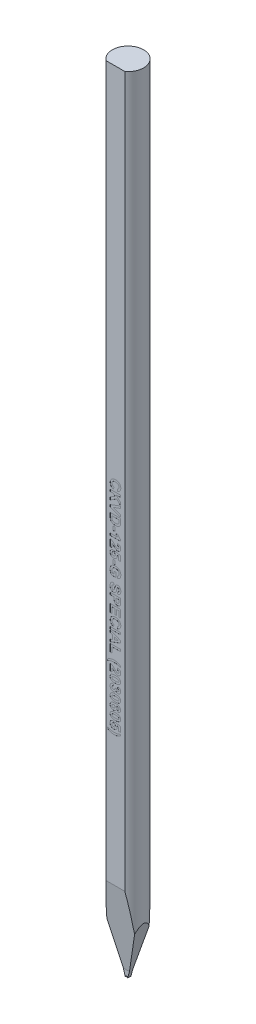
from build123d import *

# Parameters (mm, degrees)
SKETCH_TL_CUTTING_R       = 1.4986
TL_CUTTING_DEPTH          = 75.9968
SKETCH_TDF_GRINDING_W     = 3.0172
SKETCH_TDF_GRINDING_H     = 3.0172
TDF_GRINDING_DEPTH        = 77.026345527
SKETCH_ENGRAVING_W        = 0.166666667
SKETCH_ENGRAVING_H        = 0.371794872
SKETCH_ENGRAVING_W_2      = 1
SKETCH_ENGRAVING_H_2      = 0.192307693
ENGRAVING_DEPTH           = 0.005
VW_VR_GRINDING_DEPTH      = 1.5086
VW_VR_GRINDING_DEPTH_BACK = 1.5086
ISA_GRINDING_DEPTH        = 1.5086
ISA_GRINDING_DEPTH_BACK   = 1.5086
PRE_FRX_BRX_DEPTH         = 1.5086
PRE_FRX_BRX_DEPTH_BACK    = 1.5086
SKETCH_PRE_FRX_BRX_W      = 1.35874
SKETCH_PRE_FRX_BRX_H      = 0.6096
FR_EDM_R                  = 0.0381
BR_EDM_R                  = 0.0381
FA_BA_GRINDING_DEPTH      = 1.5086
FA_BA_GRINDING_DEPTH_BACK = 1.5086


with BuildPart() as part:
    # sketch_TL_cutting → TL_cutting (new body)
    with BuildSketch(Plane(origin=(0, 0, 0), x_dir=(1, 0, 0), z_dir=(0, 1, 0))):
        Circle(SKETCH_TL_CUTTING_R)
    extrude(amount=TL_CUTTING_DEPTH)

    # sketch_TDF_grinding → TDF_grinding (cut, through all)
    with BuildSketch(Plane(origin=(0, 0, 0), x_dir=(1, 0, 0), z_dir=(0, 1, 0))):
        with Locations((0, -2.71002)):
            Rectangle(SKETCH_TDF_GRINDING_W, SKETCH_TDF_GRINDING_H)
    extrude(amount=TDF_GRINDING_DEPTH, mode=Mode.SUBTRACT)

    # sketch_engraving → engraving (cut)
    # profile 1 of 26: a face of its own
    with BuildSketch(Plane.XY.offset(1.20142)):
        with BuildLine():
            Line((-0.128205128, 41.054650256), (-0.192307692, 40.862342564))
            add(Edge.make_bspline(
                [(-0.192307692, 40.862342564), (-0.204917923, 40.866249052), (-0.229612721, 40.873899184), (-0.2649877, 40.887977804), (-0.297871332, 40.903972008), (-0.328259475, 40.921799875), (-0.356049464, 40.941535258), (-0.381471598, 40.963029244), (-0.404368127, 40.986493424), (-0.424673345, 41.011910624), (-0.442633936, 41.039003711), (-0.457816548, 41.068096053), (-0.470893242, 41.09875117), (-0.481488041, 41.131280557), (-0.489972889, 41.165468151), (-0.495577171, 41.201474413), (-0.499377062, 41.239130896), (-0.499789062, 41.264843283), (-0.5, 41.278007628)],
                knots=[0, 0, 0, 0, 1.126670901, 2.206376047, 3.246533763, 4.245677351, 5.210506282, 6.152793389, 7.083980095, 8.004497442, 8.926231833, 9.854395169, 10.801995143, 11.768203916, 12.771938831, 13.805609698, 14.87650608, 16, 16, 16, 16], degree=3))
            add(Edge.make_bspline(
                [(-0.5, 41.278007628), (-0.499663994, 41.294256309), (-0.499003061, 41.326217949), (-0.492350465, 41.372959052), (-0.481969511, 41.417500328), (-0.467601869, 41.459909613), (-0.448555271, 41.499888786), (-0.42571373, 41.537813108), (-0.398318662, 41.573249391), (-0.367249987, 41.606390716), (-0.332452821, 41.636519196), (-0.294134751, 41.662512297), (-0.253074131, 41.685050491), (-0.208709772, 41.702976594), (-0.161353037, 41.717061791), (-0.110975156, 41.726908328), (-0.057578507, 41.733074942), (-0.020984357, 41.733777083), (-0.002203526, 41.734137436)],
                knots=[0, 0, 0, 0, 1.025134988, 2.016471176, 2.973446247, 3.909197306, 4.836872559, 5.763618465, 6.698581235, 7.658772073, 8.627106982, 9.597494692, 10.576422683, 11.578339294, 12.6118974, 13.690673505, 14.814808564, 16, 16, 16, 16], degree=3))
            add(Edge.make_bspline(
                [(-0.002203526, 41.734137436), (0.017576475, 41.7337692), (0.056163648, 41.733050839), (0.112313555, 41.727002878), (0.165084042, 41.716956768), (0.214577853, 41.703380058), (0.260470573, 41.685169249), (0.303160692, 41.663313909), (0.342311169, 41.637196152), (0.377833814, 41.607271091), (0.409480853, 41.574137852), (0.437377469, 41.538433428), (0.460593243, 41.499931041), (0.479896446, 41.459107336), (0.494630503, 41.415663397), (0.505304611, 41.369716602), (0.511505561, 41.321246054), (0.512376199, 41.28810808), (0.512820513, 41.271196731)],
                knots=[0, 0, 0, 0, 1.212773307, 2.365899439, 3.458117515, 4.504331001, 5.50806732, 6.480562534, 7.440239902, 8.387651817, 9.323121479, 10.245404239, 11.160468186, 12.07454208, 13.009500751, 13.96802424, 14.963018902, 16, 16, 16, 16], degree=3))
            add(Edge.make_bspline(
                [(0.512820513, 41.271196731), (0.512448361, 41.256427276), (0.511718707, 41.227469796), (0.506761415, 41.185064506), (0.498061698, 41.144876158), (0.486319015, 41.106687521), (0.470821797, 41.070715987), (0.451884357, 41.036897111), (0.429606892, 41.005114651), (0.412205553, 40.985965065), (0.403445513, 40.976324936)],
                knots=[0, 0, 0, 0, 1.098510076, 2.153775193, 3.169777012, 4.153122333, 5.120892526, 6.076995459, 7.031936742, 8, 8, 8, 8], degree=3))
            add(Edge.make_bspline(
                [(0.403445513, 40.976324936), (0.39787141, 40.970737644), (0.386592274, 40.959431818), (0.367549896, 40.944335368), (0.347050772, 40.930022058), (0.324745215, 40.916719068), (0.30046466, 40.904846849), (0.274581981, 40.893834097), (0.246997406, 40.883695069), (0.227800247, 40.878056604), (0.217948718, 40.875163077)],
                knots=[0, 0, 0, 0, 0.885292881, 1.791380647, 2.722937556, 3.69093542, 4.703306561, 5.754477758, 6.847650944, 8, 8, 8, 8], degree=3))
            Line((0.217948718, 40.875163077), (0.179487179, 41.067470769))
            add(Edge.make_bspline(
                [(0.179487179, 41.067470769), (0.1857949, 41.069105288), (0.198219456, 41.072324861), (0.21607256, 41.07883955), (0.233014714, 41.086311208), (0.248625569, 41.0955761), (0.263619506, 41.105402074), (0.277222328, 41.117064773), (0.290109132, 41.129569754), (0.301694454, 41.143458861), (0.312145605, 41.158333589), (0.321339918, 41.174043983), (0.329014435, 41.190628478), (0.335156827, 41.207961754), (0.340319842, 41.225985702), (0.34350638, 41.244872147), (0.345953545, 41.264455752), (0.3460861, 41.277798875), (0.346153846, 41.284618205)],
                knots=[0, 0, 0, 0, 1.051114734, 2.070420253, 3.064047898, 4.034553068, 4.997066449, 5.953344811, 6.921213386, 7.892675544, 8.867420182, 9.852654213, 10.826683617, 11.811917648, 12.818610352, 13.848120519, 14.900229319, 16, 16, 16, 16], degree=3))
            add(Edge.make_bspline(
                [(0.346153846, 41.284618205), (0.345958725, 41.293982256), (0.345576529, 41.31232423), (0.341532101, 41.33905448), (0.335695112, 41.364495692), (0.326982094, 41.38855706), (0.315677399, 41.411171698), (0.302244603, 41.432668905), (0.286035184, 41.452500806), (0.26758257, 41.471139764), (0.246135655, 41.487847721), (0.221779967, 41.502550652), (0.194212535, 41.514744121), (0.163711493, 41.524644409), (0.130202077, 41.532436736), (0.093641969, 41.538001162), (0.054005962, 41.541078434), (0.026581025, 41.541573903), (0.012419872, 41.541829744)],
                knots=[0, 0, 0, 0, 0.93816214, 1.837638998, 2.704791736, 3.551915875, 4.396257554, 5.235807848, 6.087970119, 6.959042444, 7.860386085, 8.80649345, 9.804409709, 10.875695391, 12.017327537, 13.250155505, 14.580089023, 16, 16, 16, 16], degree=3))
            add(Edge.make_bspline(
                [(0.012419872, 41.541829744), (-0.002609028, 41.541576423), (-0.031567402, 41.541088312), (-0.073337178, 41.538011685), (-0.111754322, 41.532411705), (-0.14688701, 41.524722849), (-0.178713725, 41.514772973), (-0.207179389, 41.502599106), (-0.23231734, 41.488126701), (-0.254110839, 41.471378275), (-0.272831387, 41.452777256), (-0.288926796, 41.432827439), (-0.302688307, 41.411646524), (-0.314010391, 41.389107053), (-0.322575422, 41.365123298), (-0.328786932, 41.339892371), (-0.332735688, 41.313321695), (-0.333131326, 41.295115799), (-0.333333333, 41.285820128)],
                knots=[0, 0, 0, 0, 1.475208372, 2.842499301, 4.107722225, 5.282836115, 6.369007568, 7.375918121, 8.315702116, 9.208439171, 10.065831443, 10.90006451, 11.71996243, 12.54067204, 13.369972975, 14.214060185, 15.088124569, 16, 16, 16, 16], degree=3))
            add(Edge.make_bspline(
                [(-0.333333333, 41.285820128), (-0.333161634, 41.278937953), (-0.332824013, 41.265405176), (-0.330681155, 41.245402689), (-0.326591822, 41.22620438), (-0.321184418, 41.207716281), (-0.314399721, 41.189866559), (-0.305696319, 41.17292748), (-0.295693052, 41.156565777), (-0.283969989, 41.14112094), (-0.270808612, 41.126386156), (-0.255597341, 41.112947159), (-0.238701667, 41.100481373), (-0.220008678, 41.089146947), (-0.199678377, 41.07856516), (-0.177394008, 41.069562121), (-0.153515697, 41.061174984), (-0.136789345, 41.056863153), (-0.128205128, 41.054650256)],
                knots=[0, 0, 0, 0, 0.980177776, 1.927374078, 2.859849964, 3.771585772, 4.668674471, 5.574490016, 6.479656464, 7.396337719, 8.332153134, 9.288470092, 10.28125149, 11.318486971, 12.398724812, 13.541284404, 14.738150009, 16, 16, 16, 16], degree=3))
        make_face()
    # profile 2 of 26: a face of its own
    with BuildSketch(Plane.XY.offset(1.20142)):
        Polygon((-0.5, 40.695675897), (0.5, 40.695675897), (0.5, 40.503368205), (0.052283654, 40.503368205), (0.5, 40.081693526), (0.5, 39.817470769), (0.11338141, 40.197278462), (-0.5, 39.804650256), (-0.5, 40.060860192), (-0.035456731, 40.343111795), (-0.198517628, 40.503368205), (-0.5, 40.503368205), align=None)
    # profile 3 of 26: a face of its own
    with BuildSketch(Plane.XY.offset(1.20142)):
        Polygon((-0.5, 39.428448333), (0.5, 39.79824), (0.5, 39.595115), (-0.243589744, 39.330291282), (0.5, 39.066469167), (0.5, 38.862342564), (-0.5, 39.230731987), align=None)
    # profile 4 of 26: a face of its own
    with BuildSketch(Plane.XY.offset(1.20142)):
        with BuildLine():
            Line((0.5, 38.772598974), (0.5, 38.405812115))
            add(Edge.make_bspline(
                [(0.5, 38.405812115), (0.500005193, 38.395794571), (0.500015306, 38.376288084), (0.498840892, 38.347979066), (0.497659587, 38.321506494), (0.495294873, 38.296946352), (0.492816233, 38.274213432), (0.489678088, 38.253266942), (0.485656212, 38.234239202), (0.482484481, 38.222240319), (0.480969551, 38.216509231)],
                knots=[0, 0, 0, 0, 1.259756885, 2.453039283, 3.563158368, 4.591894114, 5.55549294, 6.43918076, 7.254497783, 8, 8, 8, 8], degree=3))
            add(Edge.make_bspline(
                [(0.480969551, 38.216509231), (0.478637325, 38.209340254), (0.474014881, 38.195131431), (0.465827813, 38.174278378), (0.455960096, 38.154444479), (0.445111978, 38.135169819), (0.432903728, 38.116897553), (0.419595761, 38.099182873), (0.404753223, 38.082549803), (0.383633179, 38.06101514), (0.35420815, 38.036590255), (0.315375005, 38.01075972), (0.272594656, 37.989022014), (0.234409605, 37.973830641), (0.20183843, 37.963786542), (0.175754603, 37.957218141), (0.148301213, 37.951546468), (0.119383738, 37.947296292), (0.08913491, 37.943634906), (0.057465542, 37.941007238), (0.024383276, 37.93970625), (0.001870575, 37.939414494), (-0.009615385, 37.939265641)],
                knots=[0, 0, 0, 0, 0.745431882, 1.477436776, 2.212739876, 2.934276521, 3.663147754, 4.384200836, 5.123377481, 5.865761747, 7.365547505, 8.894711587, 10.468722596, 12.101948761, 12.951987285, 13.837595333, 14.760899389, 15.722756883, 16.726861385, 17.773652936, 18.864119771, 20, 20, 20, 20], degree=3))
            add(Edge.make_bspline(
                [(-0.009615385, 37.939265641), (-0.0294616, 37.939657046), (-0.067834928, 37.94041384), (-0.123301552, 37.946011211), (-0.17465514, 37.955306648), (-0.206804138, 37.965017075), (-0.222355769, 37.969714359)],
                knots=[0, 0, 0, 0, 1.103491527, 2.133638164, 3.0971734, 4, 4, 4, 4], degree=3))
            add(Edge.make_bspline(
                [(-0.222355769, 37.969714359), (-0.231274521, 37.972888003), (-0.248819098, 37.979131057), (-0.274127236, 37.990055932), (-0.298211673, 38.001860337), (-0.321053432, 38.014642184), (-0.342549771, 38.028466052), (-0.362636394, 38.043383645), (-0.381577746, 38.059163731), (-0.393236239, 38.07059549), (-0.399038462, 38.076284872)],
                knots=[0, 0, 0, 0, 1.090884612, 2.145940218, 3.175104604, 4.181306866, 5.161203701, 6.118658341, 7.063689906, 8, 8, 8, 8], degree=3))
            add(Edge.make_bspline(
                [(-0.399038462, 38.076284872), (-0.407300305, 38.085571145), (-0.424264154, 38.104638431), (-0.445652736, 38.13798995), (-0.464086504, 38.175865276), (-0.473760833, 38.203179168), (-0.478766026, 38.217310513)],
                knots=[0, 0, 0, 0, 0.912008655, 1.872605891, 2.89935344, 4, 4, 4, 4], degree=3))
            add(Edge.make_bspline(
                [(-0.478766026, 38.217310513), (-0.4805228, 38.223030486), (-0.484168894, 38.234901996), (-0.488062998, 38.253725444), (-0.492165475, 38.273819947), (-0.49463687, 38.295417223), (-0.497243066, 38.318293081), (-0.498706299, 38.342629822), (-0.49974511, 38.368343081), (-0.499913777, 38.385979175), (-0.5, 38.394994808)],
                knots=[0, 0, 0, 0, 0.799129865, 1.658552685, 2.566799617, 3.538529252, 4.561352959, 5.643373779, 6.795284424, 8, 8, 8, 8], degree=3))
            Line((-0.5, 38.394994808), (-0.5, 38.772598974))
            Line((-0.5, 38.772598974), (0.5, 38.772598974))
        make_face()
        with BuildLine():
            Line((0.333333333, 38.580291282), (-0.333333333, 38.580291282))
            Line((-0.333333333, 38.580291282), (-0.333333333, 38.422038077))
            add(Edge.make_bspline(
                [(-0.333333333, 38.422038077), (-0.333276671, 38.41489336), (-0.333167574, 38.401137049), (-0.332847006, 38.381231316), (-0.331979167, 38.362938115), (-0.331080228, 38.346161614), (-0.329595022, 38.33094549), (-0.328134266, 38.317223535), (-0.326090699, 38.305072132), (-0.324477534, 38.297567127), (-0.323717949, 38.294033269)],
                knots=[0, 0, 0, 0, 1.333384787, 2.567275092, 3.714769766, 4.750907381, 5.701951617, 6.567520054, 7.325492842, 8, 8, 8, 8], degree=3))
            add(Edge.make_bspline(
                [(-0.323717949, 38.294033269), (-0.321509316, 38.285756575), (-0.317207482, 38.269635757), (-0.307617456, 38.247000499), (-0.296048139, 38.226518507), (-0.282136533, 38.20784677), (-0.26455548, 38.19101967), (-0.242070693, 38.176655683), (-0.215254411, 38.163362192), (-0.189584523, 38.154258806), (-0.16665678, 38.147724413), (-0.147412959, 38.143301165), (-0.126593091, 38.139805591), (-0.104279343, 38.136798942), (-0.080500412, 38.134369499), (-0.055170426, 38.132857784), (-0.028320392, 38.131826029), (-0.009883527, 38.131659161), (-0.000400641, 38.131573333)],
                knots=[0, 0, 0, 0, 1.038686998, 2.023088296, 2.974059649, 3.888265163, 4.839857954, 5.909819677, 7.113156087, 8.466843969, 9.20827164, 10.006482943, 10.861893492, 11.769681931, 12.739021491, 13.762258324, 14.849031541, 16, 16, 16, 16], degree=3))
            add(Edge.make_bspline(
                [(-0.000400641, 38.131573333), (0.009082275, 38.1316585), (0.027452469, 38.131823485), (0.054102292, 38.132853664), (0.079033415, 38.134356863), (0.102276578, 38.136803691), (0.123864169, 38.139763456), (0.143813574, 38.143300891), (0.161996804, 38.147694423), (0.183589283, 38.154247511), (0.207947697, 38.164084996), (0.23429421, 38.177911199), (0.2571147, 38.194176402), (0.276689574, 38.212531558), (0.29287817, 38.233618569), (0.306422028, 38.256989371), (0.316938162, 38.283120279), (0.321416742, 38.301709318), (0.323717949, 38.311260833)],
                knots=[0, 0, 0, 0, 1.118059345, 2.165891593, 3.144157881, 4.062285166, 4.920717571, 5.712910489, 6.449981617, 7.12489426, 8.371943983, 9.541298068, 10.624898781, 11.666293176, 12.69306237, 13.747704633, 14.842713931, 16, 16, 16, 16], degree=3))
            add(Edge.make_bspline(
                [(0.323717949, 38.311260833), (0.324486218, 38.315395143), (0.326177652, 38.324497311), (0.328151987, 38.339601571), (0.329628909, 38.357388179), (0.331099472, 38.377817116), (0.331977905, 38.400867064), (0.332859431, 38.426572571), (0.333166326, 38.454956851), (0.333276065, 38.474789207), (0.333333333, 38.485139038)],
                knots=[0, 0, 0, 0, 0.578739524, 1.274162912, 2.095457587, 3.035141998, 4.093102578, 5.270121571, 6.575369351, 8, 8, 8, 8], degree=3))
            Line((0.333333333, 38.485139038), (0.333333333, 38.580291282))
        make_face(mode=Mode.SUBTRACT)
    # profile 5 of 26: a face of its own
    with BuildSketch(Plane.XY.offset(1.20142)):
        with Locations((-0.147435898, 37.612342564)):
            Rectangle(SKETCH_ENGRAVING_W, SKETCH_ENGRAVING_H)
    # profile 6 of 26: a face of its own
    with BuildSketch(Plane.XY.offset(1.20142)):
        with BuildLine():
            Line((-0.5, 36.875163077), (-0.5, 37.067470769))
            Line((-0.5, 37.067470769), (0.211939103, 37.067470769))
            add(Edge.make_bspline(
                [(0.211939103, 37.067470769), (0.20307606, 37.076174852), (0.185434563, 37.093499945), (0.161132143, 37.121338193), (0.138107764, 37.149869498), (0.117325964, 37.179928613), (0.097979723, 37.210935994), (0.080691796, 37.243290822), (0.064587624, 37.276491895), (0.055729116, 37.299506792), (0.051282051, 37.311060513)],
                knots=[0, 0, 0, 0, 1.012608143, 2.015552075, 3.011331447, 4.000718745, 4.993456561, 5.989905615, 6.990911433, 8, 8, 8, 8], degree=3))
            Line((0.051282051, 37.311060513), (0.243589744, 37.311060513))
            add(Edge.make_bspline(
                [(0.243589744, 37.311060513), (0.248390063, 37.298252321), (0.258436757, 37.271445773), (0.279872721, 37.231860485), (0.306240788, 37.190450478), (0.332145905, 37.15570628), (0.355392216, 37.128380145), (0.373871139, 37.109138315), (0.392879523, 37.091314424), (0.412934946, 37.075563655), (0.433647484, 37.061485979), (0.454979242, 37.049011891), (0.476998664, 37.038031997), (0.492332462, 37.032284073), (0.5, 37.029409872)],
                knots=[0, 0, 0, 0, 1.253621181, 2.623731602, 4.119264342, 5.756158754, 6.594718004, 7.409281336, 8.202581069, 8.983291728, 9.746205797, 10.498494251, 11.24918464, 12, 12, 12, 12], degree=3))
            Line((0.5, 37.029409872), (0.5, 36.875163077))
            Line((0.5, 36.875163077), (-0.5, 36.875163077))
        make_face()
    # profile 7 of 26: a face of its own
    with BuildSketch(Plane.XY.offset(1.20142)):
        with BuildLine():
            Line((-0.307692308, 35.939265641), (-0.5, 35.939265641))
            Line((-0.5, 35.939265641), (-0.5, 36.593111795))
            add(Edge.make_bspline(
                [(-0.5, 36.593111795), (-0.483565984, 36.59089373), (-0.450707166, 36.586458845), (-0.402658764, 36.572832053), (-0.355879438, 36.554307325), (-0.317848438, 36.534401803), (-0.286923212, 36.515045861), (-0.262057708, 36.496834141), (-0.235074392, 36.475804437), (-0.206603976, 36.451253805), (-0.176093602, 36.423794752), (-0.14381225, 36.393085754), (-0.109876761, 36.359029959), (-0.086834533, 36.335068881), (-0.074919872, 36.322679103)],
                knots=[0, 0, 0, 0, 1.156381417, 2.312114436, 3.475445649, 4.663832578, 5.302694182, 6.020660876, 6.814180865, 7.69035705, 8.644181007, 9.679458435, 10.800095821, 12, 12, 12, 12], degree=3))
            add(Edge.make_bspline(
                [(-0.074919872, 36.322679103), (-0.065377972, 36.312790203), (-0.047213006, 36.293964652), (-0.021173696, 36.267186037), (0.002635387, 36.243578859), (0.024062885, 36.22300659), (0.042867348, 36.205195407), (0.059484162, 36.190624125), (0.073602098, 36.178838337), (0.082565079, 36.172461256), (0.086538462, 36.169634231)],
                knots=[0, 0, 0, 0, 1.480739016, 2.818890974, 4.024686436, 5.093297083, 6.019761393, 6.815071481, 7.474708909, 8, 8, 8, 8], degree=3))
            add(Edge.make_bspline(
                [(0.086538462, 36.169634231), (0.096145343, 36.163815339), (0.114654059, 36.152604601), (0.143960972, 36.14074553), (0.173010268, 36.133005463), (0.192528875, 36.132045306), (0.202123397, 36.131573333)],
                knots=[0, 0, 0, 0, 1.091434863, 2.102769638, 3.067401785, 4, 4, 4, 4], degree=3))
            add(Edge.make_bspline(
                [(0.202123397, 36.131573333), (0.212103794, 36.131926794), (0.230985925, 36.132595515), (0.257559137, 36.138388518), (0.280564781, 36.148216582), (0.299731306, 36.162229793), (0.314878913, 36.17987879), (0.325894297, 36.200635821), (0.332110851, 36.224573647), (0.33291372, 36.24137959), (0.333333333, 36.250163077)],
                knots=[0, 0, 0, 0, 1.192552326, 2.256215989, 3.232470907, 4.163657734, 5.069678789, 5.991331675, 6.950186205, 8, 8, 8, 8], degree=3))
            add(Edge.make_bspline(
                [(0.333333333, 36.250163077), (0.332938162, 36.258885314), (0.332174776, 36.275734793), (0.325505939, 36.299681559), (0.313961482, 36.320630559), (0.30080546, 36.335559931), (0.288012183, 36.345645429), (0.276863686, 36.352517336), (0.264195574, 36.358440384), (0.250150469, 36.363688698), (0.23456747, 36.367834273), (0.217565257, 36.371172861), (0.199052334, 36.37386328), (0.186173423, 36.374718881), (0.179487179, 36.375163077)],
                knots=[0, 0, 0, 0, 1.402788338, 2.709884207, 3.961032948, 5.225417836, 5.883680772, 6.578928686, 7.329201998, 8.132101139, 8.990263233, 9.922304639, 10.921339128, 12, 12, 12, 12], degree=3))
            Line((0.179487179, 36.375163077), (0.198317308, 36.567470769))
            add(Edge.make_bspline(
                [(0.198317308, 36.567470769), (0.211300501, 36.565924645), (0.236472838, 36.562926958), (0.272628993, 36.555446178), (0.305984679, 36.545972048), (0.336477992, 36.534052904), (0.364302841, 36.520181378), (0.389041697, 36.503649908), (0.410968596, 36.48503612), (0.430071868, 36.464323927), (0.446412285, 36.441645005), (0.460998615, 36.417847545), (0.472964043, 36.392466479), (0.482825353, 36.365781253), (0.490706433, 36.337803927), (0.495917297, 36.308405102), (0.499582638, 36.277766216), (0.499858783, 36.256851985), (0.5, 36.246156667)],
                knots=[0, 0, 0, 0, 1.270971563, 2.464210789, 3.586263665, 4.638946707, 5.643716971, 6.603612468, 7.52484387, 8.434700188, 9.336036235, 10.239171475, 11.145359471, 12.059630629, 13.003312604, 13.96741569, 14.960557767, 16, 16, 16, 16], degree=3))
            add(Edge.make_bspline(
                [(0.5, 36.246156667), (0.499776553, 36.234529459), (0.499341362, 36.211884013), (0.495746905, 36.178825933), (0.489481026, 36.147769303), (0.48117587, 36.118446916), (0.470106061, 36.091144654), (0.456633778, 36.065641031), (0.440545401, 36.042195198), (0.422288069, 36.020781878), (0.402418882, 36.00156264), (0.380890105, 35.985108357), (0.358545244, 35.970662556), (0.334632005, 35.959322632), (0.309750235, 35.950083646), (0.283460918, 35.94413893), (0.256153456, 35.93979187), (0.237464899, 35.939442991), (0.227964744, 35.939265641)],
                knots=[0, 0, 0, 0, 1.21054264, 2.357683783, 3.456743179, 4.506371233, 5.526380269, 6.518616322, 7.504105716, 8.480749833, 9.444588379, 10.376395364, 11.298423092, 12.209585683, 13.126776925, 14.056012185, 15.011791738, 16, 16, 16, 16], degree=3))
            add(Edge.make_bspline(
                [(0.227964744, 35.939265641), (0.217064496, 35.939510753), (0.195440077, 35.939997019), (0.163469012, 35.944637463), (0.132249846, 35.95176211), (0.101610438, 35.96216983), (0.071147148, 35.975842099), (0.040108962, 35.992579636), (0.008522341, 36.012852701), (-0.012178306, 36.028278447), (-0.022836538, 36.036220769)],
                knots=[0, 0, 0, 0, 0.953498, 1.891593709, 2.82157134, 3.753035249, 4.718494268, 5.740911752, 6.836853288, 8, 8, 8, 8], degree=3))
            add(Edge.make_bspline(
                [(-0.022836538, 36.036220769), (-0.026670091, 36.039259514), (-0.034880672, 36.0457678), (-0.047378398, 36.0568734), (-0.061345658, 36.069477883), (-0.076193638, 36.084159221), (-0.092563957, 36.100378211), (-0.109838998, 36.118564609), (-0.128325502, 36.138534679), (-0.147648705, 36.15948585), (-0.166391428, 36.180646854), (-0.184247543, 36.199993147), (-0.20029985, 36.217325953), (-0.214732899, 36.232477917), (-0.227268639, 36.245715167), (-0.238167377, 36.256785188), (-0.247265417, 36.265866315), (-0.26144337, 36.278382593), (-0.280620183, 36.294307112), (-0.298943771, 36.305510955), (-0.307692308, 36.310860192)],
                knots=[0, 0, 0, 0, 0.665546509, 1.425446362, 2.274432636, 3.225431318, 4.2662943, 5.410247296, 6.638261485, 7.969509561, 9.288545809, 10.484715594, 11.551975365, 12.503234464, 13.332293902, 14.032657109, 14.617374704, 15.080693821, 16.606187002, 18, 18, 18, 18], degree=3))
            Line((-0.307692308, 36.310860192), (-0.307692308, 35.939265641))
        make_face()
    # profile 8 of 26: a face of its own
    with BuildSketch(Plane.XY.offset(1.20142)):
        with BuildLine():
            Line((-0.213942308, 35.823881026), (-0.192307692, 35.657214359))
            add(Edge.make_bspline(
                [(-0.192307692, 35.657214359), (-0.203607347, 35.655365287), (-0.225366694, 35.651804594), (-0.255826929, 35.640842289), (-0.282470914, 35.625214379), (-0.305088238, 35.605540221), (-0.323334969, 35.583097307), (-0.336523954, 35.558428423), (-0.344692684, 35.53205856), (-0.34566455, 35.513775111), (-0.346153846, 35.504570128)],
                knots=[0, 0, 0, 0, 1.155217688, 2.224562036, 3.249849536, 4.259092678, 5.238040954, 6.15568152, 7.071459712, 8, 8, 8, 8], degree=3))
            add(Edge.make_bspline(
                [(-0.346153846, 35.504570128), (-0.346059894, 35.499221574), (-0.34587598, 35.488751695), (-0.34378776, 35.473322996), (-0.340396301, 35.458583672), (-0.335789422, 35.444397438), (-0.329745146, 35.430900443), (-0.322266898, 35.418077002), (-0.313608966, 35.405769211), (-0.303697677, 35.394133735), (-0.29215854, 35.383691042), (-0.27939506, 35.374416485), (-0.265101057, 35.3668288), (-0.249674797, 35.360287437), (-0.232663378, 35.355659777), (-0.214481969, 35.351948153), (-0.194883734, 35.350062529), (-0.18142672, 35.349706079), (-0.174479167, 35.349522051)],
                knots=[0, 0, 0, 0, 0.98109136, 1.920501424, 2.850996269, 3.75396817, 4.653607445, 5.559568228, 6.474190795, 7.412641135, 8.358186253, 9.324081521, 10.300185094, 11.322066343, 12.392681767, 13.529496655, 14.72453472, 16, 16, 16, 16], degree=3))
            add(Edge.make_bspline(
                [(-0.174479167, 35.349522051), (-0.167930185, 35.349626011), (-0.155273198, 35.34982693), (-0.136935362, 35.351690991), (-0.119798482, 35.354552314), (-0.103987864, 35.359104229), (-0.089209555, 35.364302865), (-0.075987454, 35.371311975), (-0.063746794, 35.379002624), (-0.053149329, 35.388376842), (-0.04378212, 35.398589194), (-0.035449479, 35.409471526), (-0.028416647, 35.421169056), (-0.022600846, 35.433571092), (-0.018105451, 35.44673127), (-0.015265585, 35.460678292), (-0.013079926, 35.475255526), (-0.012907894, 35.485263789), (-0.012820513, 35.490347372)],
                knots=[0, 0, 0, 0, 1.292262537, 2.497510385, 3.635136149, 4.715991128, 5.741845981, 6.720379908, 7.663568786, 8.58853187, 9.502632107, 10.396263742, 11.289117461, 12.191261909, 13.095714127, 14.026387781, 14.997526353, 16, 16, 16, 16], degree=3))
            add(Edge.make_bspline(
                [(-0.012820513, 35.490347372), (-0.013050924, 35.496774203), (-0.013510598, 35.509595832), (-0.017247301, 35.52852286), (-0.02333068, 35.546945311), (-0.031799166, 35.564844039), (-0.042720432, 35.582171687), (-0.056130694, 35.598853237), (-0.071799231, 35.615175037), (-0.083638008, 35.625200833), (-0.08974359, 35.63037141)],
                knots=[0, 0, 0, 0, 0.931687088, 1.85873035, 2.786835662, 3.740075265, 4.723687035, 5.750832598, 6.840042753, 8, 8, 8, 8], degree=3))
            Line((-0.08974359, 35.63037141), (-0.066105769, 35.79824))
            Line((-0.066105769, 35.79824), (0.487179487, 35.682855385))
            Line((0.487179487, 35.682855385), (0.487179487, 35.195675897))
            Line((0.487179487, 35.195675897), (0.294871795, 35.195675897))
            Line((0.294871795, 35.195675897), (0.294871795, 35.52860859))
            Line((0.294871795, 35.52860859), (0.116386218, 35.56787141))
            add(Edge.make_bspline(
                [(0.116386218, 35.56787141), (0.122158957, 35.557866118), (0.133400829, 35.538381744), (0.144973305, 35.507274811), (0.152400706, 35.476008082), (0.153366831, 35.454930949), (0.153846154, 35.444473974)],
                knots=[0, 0, 0, 0, 1.060051984, 2.064352337, 3.039669322, 4, 4, 4, 4], degree=3))
            add(Edge.make_bspline(
                [(0.153846154, 35.444473974), (0.153581613, 35.43464353), (0.153059042, 35.415224594), (0.148771515, 35.386745103), (0.141705229, 35.359427857), (0.131871753, 35.333180611), (0.118982632, 35.308191105), (0.103404168, 35.284243913), (0.084866032, 35.261684757), (0.063903438, 35.240271251), (0.04071085, 35.220743636), (0.015420507, 35.203879987), (-0.011337699, 35.189314676), (-0.039859413, 35.177456787), (-0.070184315, 35.168527457), (-0.102051282, 35.161840252), (-0.135661543, 35.158094127), (-0.158578281, 35.157511611), (-0.170272436, 35.157214359)],
                knots=[0, 0, 0, 0, 0.974409932, 1.924837087, 2.848242317, 3.768103797, 4.697919751, 5.630842317, 6.595644344, 7.588240789, 8.59876155, 9.595918743, 10.597287627, 11.615415169, 12.652315553, 13.727511434, 14.840374562, 16, 16, 16, 16], degree=3))
            add(Edge.make_bspline(
                [(-0.170272436, 35.157214359), (-0.180095164, 35.157480651), (-0.199591316, 35.158009189), (-0.228431015, 35.161153123), (-0.256480502, 35.166863218), (-0.283660862, 35.174670645), (-0.310181667, 35.184514441), (-0.335760069, 35.196758254), (-0.360613268, 35.211251181), (-0.376286294, 35.222458447), (-0.384214744, 35.228127821)],
                knots=[0, 0, 0, 0, 1.0275977, 2.039576086, 3.029943557, 4.018141221, 4.995043124, 5.985410594, 6.980887897, 8, 8, 8, 8], degree=3))
            add(Edge.make_bspline(
                [(-0.384214744, 35.228127821), (-0.39442561, 35.236389332), (-0.414521783, 35.252648948), (-0.440928765, 35.280491257), (-0.463196136, 35.310789396), (-0.481238657, 35.343512985), (-0.495700415, 35.378390225), (-0.505577236, 35.415786022), (-0.511741284, 35.455419771), (-0.51245553, 35.482645058), (-0.512820513, 35.496557308)],
                knots=[0, 0, 0, 0, 1.018155984, 2.003849412, 2.967446846, 3.927472908, 4.896208823, 5.888955604, 6.921246412, 8, 8, 8, 8], degree=3))
            add(Edge.make_bspline(
                [(-0.512820513, 35.496557308), (-0.51261689, 35.50778638), (-0.512219305, 35.529711757), (-0.508313832, 35.561825425), (-0.50189785, 35.592304306), (-0.493201931, 35.621293414), (-0.481586571, 35.648517466), (-0.467806969, 35.674310679), (-0.451267563, 35.698476267), (-0.432181131, 35.720872086), (-0.411081442, 35.741436376), (-0.387995531, 35.759779148), (-0.363308362, 35.776099322), (-0.336770788, 35.79008566), (-0.308568836, 35.80200532), (-0.278557994, 35.811496256), (-0.246938394, 35.819310613), (-0.225062746, 35.822340692), (-0.213942308, 35.823881026)],
                knots=[0, 0, 0, 0, 1.098896741, 2.145655864, 3.16104256, 4.145315902, 5.10323158, 6.053780891, 7.003858069, 7.963890296, 8.930045353, 9.883557002, 10.846278307, 11.82296847, 12.816080213, 13.83936887, 14.901647787, 16, 16, 16, 16], degree=3))
        make_face()
    # profile 9 of 26: a face of its own
    with BuildSketch(Plane.XY.offset(1.20142)):
        with Locations((-0.147435898, 34.843111795)):
            Rectangle(SKETCH_ENGRAVING_W, SKETCH_ENGRAVING_H)
    # profile 10 of 26: a face of its own
    with BuildSketch(Plane.XY.offset(1.20142)):
        with BuildLine():
            Line((-0.128205128, 34.093111795), (0.038461538, 34.093111795))
            Line((0.038461538, 34.093111795), (0.038461538, 33.657214359))
            Line((0.038461538, 33.657214359), (-0.36338141, 33.657214359))
            add(Edge.make_bspline(
                [(-0.36338141, 33.657214359), (-0.368321434, 33.662700375), (-0.378419843, 33.6739149), (-0.392661125, 33.692212664), (-0.406257259, 33.712356779), (-0.4194836, 33.734225469), (-0.432233696, 33.757863992), (-0.444685123, 33.783178064), (-0.45671611, 33.810214391), (-0.471787381, 33.848447711), (-0.488186169, 33.89766183), (-0.502445448, 33.957827076), (-0.511191227, 34.018468267), (-0.512277771, 34.059029075), (-0.512820513, 34.079289679)],
                knots=[0, 0, 0, 0, 0.581799769, 1.189316438, 1.825828404, 2.496525428, 3.203088405, 3.942228803, 4.719818701, 5.534979611, 7.181138583, 8.803804008, 10.403462225, 12, 12, 12, 12], degree=3))
            add(Edge.make_bspline(
                [(-0.512820513, 34.079289679), (-0.512629241, 34.091982166), (-0.512252188, 34.117002831), (-0.509233571, 34.153941118), (-0.504017902, 34.189658224), (-0.496780719, 34.224090736), (-0.487836372, 34.257341646), (-0.476607913, 34.289294166), (-0.463065488, 34.319914068), (-0.447986133, 34.349430581), (-0.430657849, 34.377283177), (-0.411724289, 34.403527023), (-0.390891397, 34.427907404), (-0.36853351, 34.450636217), (-0.344060025, 34.471284803), (-0.318106216, 34.490366641), (-0.290219674, 34.507425038), (-0.260879177, 34.522751559), (-0.230317098, 34.536380942), (-0.198781008, 34.547883246), (-0.166726875, 34.557966922), (-0.134042675, 34.566254707), (-0.10062201, 34.572341654), (-0.066619552, 34.577073529), (-0.031822841, 34.579615004), (-0.008417054, 34.580064325), (0.003405449, 34.580291282)],
                knots=[0, 0, 0, 0, 1.124897971, 2.217508473, 3.282174662, 4.322209414, 5.334422951, 6.332119154, 7.320662553, 8.300074908, 9.267468154, 10.225199689, 11.165658754, 12.107290334, 13.047749399, 14.00069605, 14.959944213, 15.942088746, 16.933021067, 17.923599838, 18.915715637, 19.910475908, 20.909926025, 21.925232038, 22.952013513, 24, 24, 24, 24], degree=3))
            add(Edge.make_bspline(
                [(0.003405449, 34.580291282), (0.016165747, 34.580107383), (0.041321811, 34.579744838), (0.078501182, 34.576615194), (0.114594914, 34.571767239), (0.149519517, 34.564372247), (0.183523729, 34.555518796), (0.216299841, 34.544174109), (0.248180515, 34.531220661), (0.278688999, 34.515936543), (0.308028284, 34.499053971), (0.335510174, 34.4798704), (0.361403632, 34.4590508), (0.385591047, 34.436407968), (0.407627145, 34.411569007), (0.428063784, 34.385043308), (0.447146094, 34.35684846), (0.457908016, 34.336671736), (0.463341346, 34.326485192)],
                knots=[0, 0, 0, 0, 1.105132952, 2.178694671, 3.229818344, 4.257558797, 5.269123684, 6.27148554, 7.259679084, 8.247804916, 9.224967877, 10.189258471, 11.147685264, 12.101072275, 13.055511435, 14.02039165, 15.000562851, 16, 16, 16, 16], degree=3))
            add(Edge.make_bspline(
                [(0.463341346, 34.326485192), (0.467347168, 34.318397841), (0.475455657, 34.302027618), (0.485329628, 34.275954525), (0.494054347, 34.248586948), (0.500719187, 34.219605473), (0.506115234, 34.189318993), (0.510216979, 34.157577917), (0.512307439, 34.124323708), (0.512647258, 34.101661284), (0.512820513, 34.090106987)],
                knots=[0, 0, 0, 0, 0.887950456, 1.797368171, 2.741221183, 3.713797788, 4.722103116, 5.768966405, 6.862521341, 8, 8, 8, 8], degree=3))
            add(Edge.make_bspline(
                [(0.512820513, 34.090106987), (0.512598613, 34.075209487), (0.512167059, 34.046236604), (0.508571106, 34.00399631), (0.502373597, 33.964242674), (0.493837942, 33.926920334), (0.482863355, 33.892109697), (0.469371425, 33.859870687), (0.453633675, 33.830005429), (0.435019378, 33.802946485), (0.414494937, 33.778143918), (0.392035387, 33.755662449), (0.367607461, 33.735493031), (0.341334074, 33.717622318), (0.313106625, 33.702190967), (0.283182558, 33.688922952), (0.251334696, 33.678001769), (0.22921692, 33.672723803), (0.217948718, 33.670034872)],
                knots=[0, 0, 0, 0, 1.271135529, 2.472123572, 3.614091059, 4.701890498, 5.736279567, 6.724681829, 7.680621489, 8.611506429, 9.52200816, 10.424540711, 11.318996785, 12.221421405, 13.131851814, 14.060431888, 15.011860567, 16, 16, 16, 16], degree=3))
            Line((0.217948718, 33.670034872), (0.179487179, 33.862342564))
            add(Edge.make_bspline(
                [(0.179487179, 33.862342564), (0.185798707, 33.864245146), (0.198251232, 33.867998905), (0.216108293, 33.875305481), (0.232994438, 33.883623603), (0.248643132, 33.893450597), (0.263649233, 33.903888251), (0.277161531, 33.916158435), (0.290187329, 33.929065453), (0.301701762, 33.943556609), (0.312086782, 33.958995164), (0.321450083, 33.975216632), (0.329043783, 33.992584974), (0.335153652, 34.010857597), (0.340342569, 34.029945002), (0.343533767, 34.05009634), (0.345940549, 34.0710853), (0.346081986, 34.085425325), (0.346153846, 34.092711154)],
                knots=[0, 0, 0, 0, 1.027780279, 2.027791312, 3.006028774, 3.96000864, 4.908113241, 5.852721087, 6.802883308, 7.765918715, 8.733730415, 9.704005314, 10.683351261, 11.68471758, 12.707948499, 13.764514378, 14.864202456, 16, 16, 16, 16], degree=3))
            add(Edge.make_bspline(
                [(0.346153846, 34.092711154), (0.345859633, 34.103738511), (0.34528545, 34.125259337), (0.341538784, 34.156676876), (0.334873123, 34.186316442), (0.325679114, 34.21425554), (0.313877959, 34.240545391), (0.299029501, 34.264830737), (0.282012344, 34.28771627), (0.262039987, 34.308550747), (0.239645267, 34.32744525), (0.214561065, 34.343801822), (0.186868462, 34.357418599), (0.156706511, 34.368571515), (0.124073954, 34.377451616), (0.088855272, 34.383475764), (0.051104495, 34.387411833), (0.02505068, 34.387789093), (0.01161859, 34.38798359)],
                knots=[0, 0, 0, 0, 1.043810997, 2.037086103, 2.989314757, 3.91471467, 4.817033861, 5.710208705, 6.603920097, 7.511448416, 8.435617211, 9.371747005, 10.338444094, 11.350425613, 12.411431869, 13.5347293, 14.729025275, 16, 16, 16, 16], degree=3))
            add(Edge.make_bspline(
                [(0.01161859, 34.38798359), (-0.002813331, 34.387780916), (-0.03086261, 34.387387007), (-0.071503034, 34.383552106), (-0.109371212, 34.377253885), (-0.14440027, 34.368186527), (-0.176807311, 34.356879264), (-0.206438048, 34.342899735), (-0.233109204, 34.326091899), (-0.256980675, 34.307029064), (-0.278169336, 34.285992253), (-0.296147735, 34.262929293), (-0.31184176, 34.238671086), (-0.32420794, 34.212531286), (-0.33413508, 34.184982798), (-0.341078682, 34.155756769), (-0.345395871, 34.124958498), (-0.345897627, 34.103876945), (-0.346153846, 34.093111795)],
                knots=[0, 0, 0, 0, 1.31821493, 2.562027667, 3.72541598, 4.821825939, 5.863743127, 6.857000185, 7.808227391, 8.737146514, 9.643023621, 10.529087527, 11.404035307, 12.277173472, 13.164790074, 14.074766194, 15.016892606, 16, 16, 16, 16], degree=3))
            add(Edge.make_bspline(
                [(-0.346153846, 34.093111795), (-0.345850315, 34.082208504), (-0.34524035, 34.060297617), (-0.340086045, 34.027476537), (-0.332449955, 33.994476283), (-0.321065283, 33.962083933), (-0.307937779, 33.930697225), (-0.292687307, 33.901531024), (-0.276962331, 33.874138447), (-0.264654274, 33.857625969), (-0.258613782, 33.849522051)],
                knots=[0, 0, 0, 0, 0.993779204, 1.997065276, 3.023588959, 4.078879359, 5.123947549, 6.123456565, 7.079038607, 8, 8, 8, 8], degree=3))
            Line((-0.258613782, 33.849522051), (-0.128205128, 33.849522051))
            Line((-0.128205128, 33.849522051), (-0.128205128, 34.093111795))
        make_face()
    # profile 11 of 26: a face of its own
    with BuildSketch(Plane.XY.offset(1.20142)):
        with BuildLine():
            Line((-0.166666667, 33.131573333), (-0.153846154, 32.939265641))
            add(Edge.make_bspline(
                [(-0.153846154, 32.939265641), (-0.161891279, 32.937732992), (-0.177518424, 32.934755918), (-0.199795017, 32.928152009), (-0.220541784, 32.920845841), (-0.239662803, 32.912232964), (-0.25710555, 32.902367896), (-0.273156714, 32.891577618), (-0.28732832, 32.879334862), (-0.299925293, 32.866003176), (-0.310783278, 32.851429999), (-0.320246275, 32.835729399), (-0.328256178, 32.818808131), (-0.334922245, 32.800730819), (-0.339885492, 32.781317406), (-0.343420115, 32.760749762), (-0.345682646, 32.738994761), (-0.345994208, 32.724127096), (-0.346153846, 32.716509231)],
                knots=[0, 0, 0, 0, 1.20477517, 2.340199137, 3.415898527, 4.440826703, 5.422227366, 6.362763262, 7.28278988, 8.172822029, 9.057410505, 9.952475558, 10.866920142, 11.809098, 12.784128911, 13.811833846, 14.878831738, 16, 16, 16, 16], degree=3))
            add(Edge.make_bspline(
                [(-0.346153846, 32.716509231), (-0.346066367, 32.708490933), (-0.345896216, 32.692894929), (-0.343785338, 32.670294596), (-0.340761278, 32.649162259), (-0.335974263, 32.629684522), (-0.330620744, 32.611497658), (-0.323296559, 32.595053353), (-0.314849171, 32.580085499), (-0.305263574, 32.566632657), (-0.294632459, 32.554892348), (-0.28353392, 32.544621341), (-0.272207737, 32.535675972), (-0.260151301, 32.528635334), (-0.247852227, 32.522937439), (-0.234943611, 32.51917153), (-0.221721863, 32.516627435), (-0.212685699, 32.516335702), (-0.208133013, 32.516188718)],
                knots=[0, 0, 0, 0, 1.417779877, 2.757654889, 4.012140507, 5.189587551, 6.302846416, 7.360586765, 8.365575446, 9.33904572, 10.275781718, 11.161696098, 12.012180333, 12.822428111, 13.625933072, 14.403138519, 15.195454004, 16, 16, 16, 16], degree=3))
            add(Edge.make_bspline(
                [(-0.208133013, 32.516188718), (-0.202439146, 32.516482996), (-0.191320796, 32.517057629), (-0.175220679, 32.520827928), (-0.160658688, 32.527632431), (-0.147071392, 32.536868971), (-0.134926522, 32.549833369), (-0.123459543, 32.566237524), (-0.11316916, 32.586697237), (-0.107424402, 32.601865842), (-0.104366987, 32.609938718)],
                knots=[0, 0, 0, 0, 0.906150226, 1.7694295, 2.610923838, 3.450874087, 4.367551936, 5.419872502, 6.626831617, 8, 8, 8, 8], degree=3))
            add(Edge.make_bspline(
                [(-0.104366987, 32.609938718), (-0.103205903, 32.613402905), (-0.100607587, 32.621155194), (-0.096897182, 32.634381154), (-0.092218385, 32.650366556), (-0.087052561, 32.669259979), (-0.081545375, 32.691022885), (-0.074955523, 32.715448532), (-0.068334023, 32.742907832), (-0.063456004, 32.762120895), (-0.060897436, 32.772198333)],
                knots=[0, 0, 0, 0, 0.521824192, 1.167757792, 1.961731518, 2.901193269, 3.965386864, 5.168422915, 6.514810244, 8, 8, 8, 8], degree=3))
            add(Edge.make_bspline(
                [(-0.060897436, 32.772198333), (-0.0576208, 32.785321849), (-0.051299067, 32.810641528), (-0.040053153, 32.846753187), (-0.028879714, 32.880012685), (-0.016755933, 32.910099788), (-0.004503472, 32.937346368), (0.008737874, 32.961311704), (0.022280434, 32.9824959), (0.032402475, 32.994840422), (0.037259615, 33.000764038)],
                knots=[0, 0, 0, 0, 1.293880989, 2.496331788, 3.617634808, 4.64976062, 5.598842568, 6.473791081, 7.267636666, 8, 8, 8, 8], degree=3))
            add(Edge.make_bspline(
                [(0.037259615, 33.000764038), (0.044137694, 33.008110092), (0.057622804, 33.022512711), (0.079781426, 33.041471522), (0.103188466, 33.057402086), (0.127671148, 33.070514684), (0.153370416, 33.080611137), (0.180114252, 33.087767373), (0.207972454, 33.092399148), (0.22694455, 33.092871789), (0.236578526, 33.093111795)],
                knots=[0, 0, 0, 0, 1.064429417, 2.086912298, 3.078678339, 4.055528992, 5.020032834, 5.993708893, 6.981211098, 8, 8, 8, 8], degree=3))
            add(Edge.make_bspline(
                [(0.236578526, 33.093111795), (0.249044725, 33.092644331), (0.273773943, 33.091717024), (0.310123415, 33.08321467), (0.34519423, 33.06996628), (0.373053378, 33.054613891), (0.394102454, 33.039835366), (0.409316468, 33.027608713), (0.423234984, 33.013918899), (0.436363342, 32.999257469), (0.448421192, 32.983378333), (0.459337354, 32.966261959), (0.469762031, 32.948230204), (0.481724432, 32.921917828), (0.494501972, 32.886386959), (0.505216674, 32.840151911), (0.511620444, 32.789806137), (0.512410831, 32.754856875), (0.512820513, 32.736741603)],
                knots=[0, 0, 0, 0, 1.180224575, 2.341213254, 3.519178081, 4.726056898, 5.344182394, 5.956118988, 6.573855441, 7.192564044, 7.82049682, 8.461345463, 9.116141012, 9.79299132, 11.198532007, 12.687823846, 14.283197644, 16, 16, 16, 16], degree=3))
            add(Edge.make_bspline(
                [(0.512820513, 32.736741603), (0.512622915, 32.721908568), (0.512238592, 32.693058634), (0.508327094, 32.651240661), (0.502300976, 32.612232321), (0.493471523, 32.576097475), (0.482080613, 32.542768087), (0.468307987, 32.512179204), (0.4520288, 32.484411205), (0.433078398, 32.459759232), (0.412189308, 32.437795993), (0.389371716, 32.418636757), (0.364914548, 32.402208024), (0.338835479, 32.388403833), (0.311000478, 32.377563434), (0.281444264, 32.36960159), (0.250236407, 32.364335557), (0.228852471, 32.36301561), (0.217948718, 32.362342564)],
                knots=[0, 0, 0, 0, 1.325136797, 2.577362738, 3.74962816, 4.849499017, 5.896771726, 6.892816139, 7.842473141, 8.766187929, 9.665133525, 10.546015357, 11.42313021, 12.293255665, 13.177485873, 14.086514152, 15.024305989, 16, 16, 16, 16], degree=3))
            Line((0.217948718, 32.362342564), (0.205128205, 32.554650256))
            add(Edge.make_bspline(
                [(0.205128205, 32.554650256), (0.211158714, 32.555759181), (0.22291155, 32.557920361), (0.239739753, 32.562627468), (0.255319488, 32.567908235), (0.269550394, 32.574174545), (0.282452554, 32.581392876), (0.29405422, 32.589597056), (0.304442868, 32.598632928), (0.313348905, 32.608881396), (0.321255295, 32.62010557), (0.327770309, 32.632732058), (0.333732615, 32.646370184), (0.338229411, 32.661531156), (0.341791978, 32.67794001), (0.344434282, 32.695601538), (0.34572413, 32.714553752), (0.346007328, 32.727592118), (0.346153846, 32.734337756)],
                knots=[0, 0, 0, 0, 1.150775252, 2.242741279, 3.277646382, 4.23752694, 5.158201782, 6.048759188, 6.901533576, 7.736611693, 8.592238639, 9.472855288, 10.399741491, 11.383322377, 12.435924598, 13.551250831, 14.733094547, 16, 16, 16, 16], degree=3))
            add(Edge.make_bspline(
                [(0.346153846, 32.734337756), (0.346024502, 32.741351384), (0.345772856, 32.754996709), (0.344228543, 32.774881585), (0.34137789, 32.79353509), (0.337667048, 32.811048838), (0.332618703, 32.827399434), (0.326463073, 32.842552373), (0.319216002, 32.856576981), (0.313514257, 32.865128576), (0.310697115, 32.869353782)],
                knots=[0, 0, 0, 0, 1.186678824, 2.308736671, 3.37120409, 4.377216403, 5.334874112, 6.262130804, 7.141346615, 8, 8, 8, 8], degree=3))
            add(Edge.make_bspline(
                [(0.310697115, 32.869353782), (0.30684882, 32.874189176), (0.299395868, 32.883553832), (0.284596838, 32.893632185), (0.267881777, 32.899699376), (0.256061421, 32.900429631), (0.25, 32.900804103)],
                knots=[0, 0, 0, 0, 1.037857257, 2.010007357, 2.979541333, 4, 4, 4, 4], degree=3))
            add(Edge.make_bspline(
                [(0.25, 32.900804103), (0.244335199, 32.900497853), (0.233176443, 32.899894591), (0.217325189, 32.893809912), (0.202637862, 32.884452505), (0.194659513, 32.875709543), (0.190504808, 32.871156667)],
                knots=[0, 0, 0, 0, 0.98538058, 1.941042925, 2.927803204, 4, 4, 4, 4], degree=3))
            add(Edge.make_bspline(
                [(0.190504808, 32.871156667), (0.187808196, 32.867543373), (0.18178239, 32.859469166), (0.17412302, 32.844678818), (0.165827461, 32.826826481), (0.157717635, 32.805505163), (0.149622864, 32.780856566), (0.141170987, 32.752879191), (0.132605635, 32.72155583), (0.124310512, 32.687684901), (0.116156882, 32.653296369), (0.107242663, 32.62048034), (0.098551989, 32.589966152), (0.089442753, 32.56189529), (0.080574939, 32.536123056), (0.071467056, 32.51277464), (0.062596997, 32.491689725), (0.050400038, 32.467102375), (0.033878763, 32.439235088), (0.009862335, 32.410027027), (-0.017133698, 32.384196224), (-0.042589095, 32.366198007), (-0.064481415, 32.353834174), (-0.081932142, 32.34587317), (-0.100320809, 32.338986277), (-0.119667735, 32.333380365), (-0.140000145, 32.329317428), (-0.161162698, 32.32595511), (-0.183331155, 32.32423724), (-0.198448465, 32.324001042), (-0.206129808, 32.323881026)],
                knots=[0, 0, 0, 0, 0.511875881, 1.143829537, 1.88775736, 2.750598373, 3.734912702, 4.837306479, 6.073130119, 7.42648979, 8.801963576, 10.091065733, 11.292408984, 12.408830014, 13.446061236, 14.39066453, 15.257936293, 16.045629259, 17.510392066, 18.929669597, 20.331293837, 21.746891395, 22.460690638, 23.187651344, 23.925159671, 24.69163991, 25.474819891, 26.281170188, 27.126635539, 28, 28, 28, 28], degree=3))
            add(Edge.make_bspline(
                [(-0.206129808, 32.323881026), (-0.213213723, 32.324046052), (-0.227281693, 32.324373777), (-0.248162112, 32.326664014), (-0.268671734, 32.330205808), (-0.288836268, 32.33544888), (-0.308616053, 32.342404346), (-0.328296541, 32.350235664), (-0.347448635, 32.360028225), (-0.366087841, 32.371173722), (-0.384201522, 32.383466864), (-0.400907086, 32.397400438), (-0.416780552, 32.412141766), (-0.430830184, 32.428646877), (-0.444499814, 32.445730113), (-0.456413626, 32.464506399), (-0.467267368, 32.484374954), (-0.476944445, 32.505516878), (-0.485241283, 32.52800221), (-0.492760445, 32.55169588), (-0.498861937, 32.576821414), (-0.504102567, 32.603208353), (-0.508085093, 32.630959127), (-0.510866581, 32.660037372), (-0.512434986, 32.690450174), (-0.512690407, 32.711165604), (-0.512820513, 32.721717564)],
                knots=[0, 0, 0, 0, 0.900523777, 1.788352984, 2.667658312, 3.544829998, 4.433470602, 5.332071549, 6.235671317, 7.16456001, 8.092361829, 9.015217829, 9.927983376, 10.842405559, 11.767913001, 12.707486241, 13.664840466, 14.644960138, 15.660436429, 16.710285012, 17.80361473, 18.945755434, 20.129541241, 21.366238063, 22.658422763, 24, 24, 24, 24], degree=3))
            add(Edge.make_bspline(
                [(-0.512820513, 32.721717564), (-0.512571769, 32.736952968), (-0.512087459, 32.766616661), (-0.507752501, 32.809712681), (-0.501117535, 32.85013389), (-0.491487967, 32.887814505), (-0.47912575, 32.922800517), (-0.463898318, 32.955076188), (-0.445714308, 32.984484634), (-0.4250161, 33.011392877), (-0.401421388, 33.035432223), (-0.37543806, 33.057077857), (-0.346733609, 33.075910694), (-0.315676999, 33.092440711), (-0.28185988, 33.105929571), (-0.245840091, 33.11745756), (-0.207125792, 33.126034343), (-0.180386288, 33.129695071), (-0.166666667, 33.131573333)],
                knots=[0, 0, 0, 0, 1.217919187, 2.371317543, 3.459749122, 4.490553404, 5.476795534, 6.422548752, 7.338285933, 8.236452553, 9.131296239, 10.026155855, 10.935394819, 11.871650654, 12.834387429, 13.842485342, 14.893012909, 16, 16, 16, 16], degree=3))
        make_face()
    # profile 12 of 26: a face of its own
    with BuildSketch(Plane.XY.offset(1.20142)):
        with BuildLine():
            Line((-0.5, 32.157214359), (0.5, 32.157214359))
            Line((0.5, 32.157214359), (0.5, 31.8373025))
            add(Edge.make_bspline(
                [(0.5, 31.8373025), (0.4999852, 31.822812147), (0.499956962, 31.795164386), (0.499104777, 31.755631754), (0.497929464, 31.720037547), (0.496434625, 31.688370495), (0.494248137, 31.660714026), (0.491629455, 31.637006649), (0.488933209, 31.617139436), (0.486060508, 31.60538182), (0.484775641, 31.600123013)],
                knots=[0, 0, 0, 0, 1.460492613, 2.786636817, 3.985312262, 5.05006335, 5.98179196, 6.7807735, 7.454678796, 8, 8, 8, 8], degree=3))
            add(Edge.make_bspline(
                [(0.484775641, 31.600123013), (0.482781564, 31.593129652), (0.478823789, 31.579249469), (0.470386441, 31.559363495), (0.460608006, 31.540196563), (0.448953875, 31.521989497), (0.435630967, 31.504680356), (0.420747869, 31.488217881), (0.404237636, 31.472513536), (0.386131953, 31.457787457), (0.366525691, 31.444291434), (0.345376234, 31.432660093), (0.322847402, 31.422799617), (0.298873329, 31.414875209), (0.273610941, 31.408323309), (0.246834559, 31.404140716), (0.218752408, 31.401117196), (0.199528035, 31.400909993), (0.189703526, 31.400804103)],
                knots=[0, 0, 0, 0, 0.907183394, 1.800546498, 2.691728384, 3.591410291, 4.495216108, 5.416087871, 6.359626967, 7.337496937, 8.327236581, 9.327316132, 10.346534403, 11.393207653, 12.477041209, 13.600953845, 14.773980723, 16, 16, 16, 16], degree=3))
            add(Edge.make_bspline(
                [(0.189703526, 31.400804103), (0.174784734, 31.401112611), (0.146065241, 31.401706506), (0.104894137, 31.408355955), (0.067280604, 31.41848886), (0.03361575, 31.433329815), (0.003633111, 31.451342901), (-0.023091697, 31.471510707), (-0.046492635, 31.493993937), (-0.066210989, 31.51857317), (-0.082434, 31.544504495), (-0.096247437, 31.570503033), (-0.106871469, 31.596894207), (-0.11149992, 31.614888472), (-0.113782051, 31.623760833)],
                knots=[0, 0, 0, 0, 1.312446177, 2.526530956, 3.662051072, 4.733637382, 5.754065268, 6.735959421, 7.675686778, 8.604015004, 9.502732733, 10.365317746, 11.193993632, 12, 12, 12, 12], degree=3))
            add(Edge.make_bspline(
                [(-0.113782051, 31.623760833), (-0.114986663, 31.630093444), (-0.11752584, 31.643441831), (-0.120056937, 31.664611575), (-0.122858586, 31.687751253), (-0.124685978, 31.712956039), (-0.126397255, 31.740195443), (-0.127205205, 31.769458886), (-0.128178621, 31.80070455), (-0.128196112, 31.822210724), (-0.128205128, 31.83329609)],
                knots=[0, 0, 0, 0, 0.735353946, 1.55003838, 2.431865514, 3.394945452, 4.432993119, 5.54609699, 6.735134699, 8, 8, 8, 8], degree=3))
            Line((-0.128205128, 31.83329609), (-0.128205128, 31.964906667))
            Line((-0.128205128, 31.964906667), (-0.5, 31.964906667))
            Line((-0.5, 31.964906667), (-0.5, 32.157214359))
        make_face()
        with BuildLine():
            Line((0.333333333, 31.964906667), (0.038461538, 31.964906667))
            Line((0.038461538, 31.964906667), (0.038461538, 31.849522051))
            add(Edge.make_bspline(
                [(0.038461538, 31.849522051), (0.038474423, 31.839571925), (0.038499073, 31.820536082), (0.039383856, 31.79322387), (0.040463899, 31.76850083), (0.04225159, 31.746315304), (0.044607724, 31.726801209), (0.047425958, 31.709827865), (0.050450217, 31.695375489), (0.055461898, 31.679747212), (0.063570342, 31.66303746), (0.075224213, 31.645193407), (0.089157789, 31.629517429), (0.105522293, 31.616472937), (0.123704204, 31.606053276), (0.143517189, 31.598592791), (0.164632877, 31.593775563), (0.179260262, 31.593335553), (0.186698718, 31.593111795)],
                knots=[0, 0, 0, 0, 1.411705958, 2.700771114, 3.876961699, 4.922619712, 5.858038221, 6.66485904, 7.363650596, 7.950905807, 8.989198271, 9.987739806, 10.967313358, 11.951275539, 12.944273208, 13.927870418, 14.946261014, 16, 16, 16, 16], degree=3))
            add(Edge.make_bspline(
                [(0.186698718, 31.593111795), (0.195758642, 31.59342671), (0.213324639, 31.594037288), (0.238341551, 31.600770263), (0.261044702, 31.611158473), (0.280727694, 31.626010665), (0.297279472, 31.643951763), (0.31105114, 31.664116808), (0.320688658, 31.686936434), (0.32442284, 31.703086613), (0.326322115, 31.711300897)],
                knots=[0, 0, 0, 0, 1.085904563, 2.105425768, 3.088705091, 4.068969419, 5.045188284, 6.010769642, 6.988240112, 8, 8, 8, 8], degree=3))
            add(Edge.make_bspline(
                [(0.326322115, 31.711300897), (0.326887477, 31.714835692), (0.328142404, 31.722681839), (0.329452077, 31.735723732), (0.330643223, 31.751152293), (0.331621189, 31.768986121), (0.332385732, 31.789154526), (0.333055661, 31.811724032), (0.333109481, 31.8366352), (0.333256648, 31.854062813), (0.333333333, 31.863143846)],
                knots=[0, 0, 0, 0, 0.564603001, 1.253243608, 2.066786758, 3.005752288, 4.070476343, 5.250658742, 6.567396469, 8, 8, 8, 8], degree=3))
            Line((0.333333333, 31.863143846), (0.333333333, 31.964906667))
        make_face(mode=Mode.SUBTRACT)
    # profile 13 of 26: a face of its own
    with BuildSketch(Plane.XY.offset(1.20142)):
        Polygon((-0.5, 31.234137436), (0.5, 31.234137436), (0.5, 30.490547692), (0.333333333, 30.490547692), (0.333333333, 31.041829744), (0.115384615, 31.041829744), (0.115384615, 30.529009231), (-0.051282051, 30.529009231), (-0.051282051, 31.041829744), (-0.333333333, 31.041829744), (-0.333333333, 30.477727179), (-0.5, 30.477727179), align=None)
    # profile 14 of 26: a face of its own
    with BuildSketch(Plane.XY.offset(1.20142)):
        with BuildLine():
            Line((-0.128205128, 29.670034872), (-0.192307692, 29.477727179))
            add(Edge.make_bspline(
                [(-0.192307692, 29.477727179), (-0.204917923, 29.481633667), (-0.229612721, 29.489283799), (-0.2649877, 29.503362419), (-0.297871332, 29.519356624), (-0.328259475, 29.537184491), (-0.356049464, 29.556919873), (-0.381471598, 29.578413859), (-0.404368127, 29.601878039), (-0.424673345, 29.62729524), (-0.442633936, 29.654388327), (-0.457816548, 29.683480669), (-0.470893242, 29.714135786), (-0.481488041, 29.746665172), (-0.489972889, 29.780852767), (-0.495577171, 29.816859029), (-0.499377062, 29.854515511), (-0.499789062, 29.880227899), (-0.5, 29.893392244)],
                knots=[0, 0, 0, 0, 1.126670901, 2.206376047, 3.246533763, 4.245677351, 5.210506282, 6.152793389, 7.083980095, 8.004497442, 8.926231833, 9.854395169, 10.801995143, 11.768203916, 12.771938831, 13.805609698, 14.87650608, 16, 16, 16, 16], degree=3))
            add(Edge.make_bspline(
                [(-0.5, 29.893392244), (-0.499663994, 29.909640924), (-0.499003061, 29.941602564), (-0.492350465, 29.988343667), (-0.481969511, 30.032884943), (-0.467601869, 30.075294229), (-0.448555271, 30.115273401), (-0.42571373, 30.153197723), (-0.398318662, 30.188634006), (-0.367249987, 30.221775331), (-0.332452821, 30.251903811), (-0.294134751, 30.277896912), (-0.253074131, 30.300435107), (-0.208709772, 30.318361209), (-0.161353037, 30.332446406), (-0.110975156, 30.342292944), (-0.057578507, 30.348459557), (-0.020984357, 30.349161699), (-0.002203526, 30.349522051)],
                knots=[0, 0, 0, 0, 1.025134988, 2.016471176, 2.973446247, 3.909197306, 4.836872559, 5.763618465, 6.698581235, 7.658772073, 8.627106982, 9.597494692, 10.576422683, 11.578339294, 12.6118974, 13.690673505, 14.814808564, 16, 16, 16, 16], degree=3))
            add(Edge.make_bspline(
                [(-0.002203526, 30.349522051), (0.017576475, 30.349153815), (0.056163648, 30.348435454), (0.112313555, 30.342387493), (0.165084042, 30.332341384), (0.214577853, 30.318764673), (0.260470573, 30.300553864), (0.303160692, 30.278698524), (0.342311169, 30.252580767), (0.377833814, 30.222655706), (0.409480853, 30.189522467), (0.437377469, 30.153818043), (0.460593243, 30.115315656), (0.479896446, 30.074491952), (0.494630503, 30.031048013), (0.505304611, 29.985101217), (0.511505561, 29.93663067), (0.512376199, 29.903492696), (0.512820513, 29.886581346)],
                knots=[0, 0, 0, 0, 1.212773307, 2.365899439, 3.458117515, 4.504331001, 5.50806732, 6.480562534, 7.440239902, 8.387651817, 9.323121479, 10.245404239, 11.160468186, 12.07454208, 13.009500751, 13.96802424, 14.963018902, 16, 16, 16, 16], degree=3))
            add(Edge.make_bspline(
                [(0.512820513, 29.886581346), (0.512448361, 29.871811892), (0.511718707, 29.842854411), (0.506761415, 29.800449121), (0.498061698, 29.760260773), (0.486319015, 29.722072137), (0.470821797, 29.686100602), (0.451884357, 29.652281727), (0.429606892, 29.620499266), (0.412205553, 29.60134968), (0.403445513, 29.591709551)],
                knots=[0, 0, 0, 0, 1.098510076, 2.153775193, 3.169777012, 4.153122333, 5.120892526, 6.076995459, 7.031936742, 8, 8, 8, 8], degree=3))
            add(Edge.make_bspline(
                [(0.403445513, 29.591709551), (0.39787141, 29.586122259), (0.386592274, 29.574816434), (0.367549896, 29.559719984), (0.347050772, 29.545406673), (0.324745215, 29.532103684), (0.30046466, 29.520231464), (0.274581981, 29.509218712), (0.246997406, 29.499079685), (0.227800247, 29.49344122), (0.217948718, 29.490547692)],
                knots=[0, 0, 0, 0, 0.885292881, 1.791380647, 2.722937556, 3.69093542, 4.703306561, 5.754477758, 6.847650944, 8, 8, 8, 8], degree=3))
            Line((0.217948718, 29.490547692), (0.179487179, 29.682855385))
            add(Edge.make_bspline(
                [(0.179487179, 29.682855385), (0.1857949, 29.684489903), (0.198219456, 29.687709477), (0.21607256, 29.694224165), (0.233014714, 29.701695823), (0.248625569, 29.710960715), (0.263619506, 29.72078669), (0.277222328, 29.732449388), (0.290109132, 29.74495437), (0.301694454, 29.758843477), (0.312145605, 29.773718204), (0.321339918, 29.789428598), (0.329014435, 29.806013093), (0.335156827, 29.82334637), (0.340319842, 29.841370317), (0.34350638, 29.860256762), (0.345953545, 29.879840368), (0.3460861, 29.893183491), (0.346153846, 29.900002821)],
                knots=[0, 0, 0, 0, 1.051114734, 2.070420253, 3.064047898, 4.034553068, 4.997066449, 5.953344811, 6.921213386, 7.892675544, 8.867420182, 9.852654213, 10.826683617, 11.811917648, 12.818610352, 13.848120519, 14.900229319, 16, 16, 16, 16], degree=3))
            add(Edge.make_bspline(
                [(0.346153846, 29.900002821), (0.345958725, 29.909366872), (0.345576529, 29.927708845), (0.341532101, 29.954439095), (0.335695112, 29.979880307), (0.326982094, 30.003941675), (0.315677399, 30.026556313), (0.302244603, 30.048053521), (0.286035184, 30.067885421), (0.26758257, 30.086524379), (0.246135655, 30.103232337), (0.221779967, 30.117935267), (0.194212535, 30.130128736), (0.163711493, 30.140029024), (0.130202077, 30.147821351), (0.093641969, 30.153385777), (0.054005962, 30.156463049), (0.026581025, 30.156958518), (0.012419872, 30.157214359)],
                knots=[0, 0, 0, 0, 0.93816214, 1.837638998, 2.704791736, 3.551915875, 4.396257554, 5.235807848, 6.087970119, 6.959042444, 7.860386085, 8.80649345, 9.804409709, 10.875695391, 12.017327537, 13.250155505, 14.580089023, 16, 16, 16, 16], degree=3))
            add(Edge.make_bspline(
                [(0.012419872, 30.157214359), (-0.002609028, 30.156961038), (-0.031567402, 30.156472928), (-0.073337178, 30.153396301), (-0.111754322, 30.14779632), (-0.14688701, 30.140107464), (-0.178713725, 30.130157589), (-0.207179389, 30.117983722), (-0.23231734, 30.103511317), (-0.254110839, 30.086762891), (-0.272831387, 30.068161872), (-0.288926796, 30.048212054), (-0.302688307, 30.027031139), (-0.314010391, 30.004491668), (-0.322575422, 29.980507913), (-0.328786932, 29.955276986), (-0.332735688, 29.92870631), (-0.333131326, 29.910500415), (-0.333333333, 29.901204744)],
                knots=[0, 0, 0, 0, 1.475208372, 2.842499301, 4.107722225, 5.282836115, 6.369007568, 7.375918121, 8.315702116, 9.208439171, 10.065831443, 10.90006451, 11.71996243, 12.54067204, 13.369972975, 14.214060185, 15.088124569, 16, 16, 16, 16], degree=3))
            add(Edge.make_bspline(
                [(-0.333333333, 29.901204744), (-0.333161634, 29.894322568), (-0.332824013, 29.880789791), (-0.330681155, 29.860787304), (-0.326591822, 29.841588996), (-0.321184418, 29.823100896), (-0.314399721, 29.805251174), (-0.305696319, 29.788312096), (-0.295693052, 29.771950392), (-0.283969989, 29.756505555), (-0.270808612, 29.741770772), (-0.255597341, 29.728331774), (-0.238701667, 29.715865989), (-0.220008678, 29.704531562), (-0.199678377, 29.693949775), (-0.177394008, 29.684946737), (-0.153515697, 29.6765596), (-0.136789345, 29.672247769), (-0.128205128, 29.670034872)],
                knots=[0, 0, 0, 0, 0.980177776, 1.927374078, 2.859849964, 3.771585772, 4.668674471, 5.574490016, 6.479656464, 7.396337719, 8.332153134, 9.288470092, 10.28125149, 11.318486971, 12.398724812, 13.541284404, 14.738150009, 16, 16, 16, 16], degree=3))
        make_face()
    # profile 15 of 26: a face of its own
    with BuildSketch(Plane.XY.offset(1.20142)):
        with Locations((0, 29.22772718)):
            Rectangle(SKETCH_ENGRAVING_W_2, SKETCH_ENGRAVING_H_2)
    # profile 16 of 26: a face of its own
    with BuildSketch(Plane.XY.offset(1.20142)):
        Polygon((-0.5, 28.067470769), (-0.5, 28.271397051), (-0.269230769, 28.355731987), (-0.269230769, 28.73954609), (-0.5, 28.823881026), (-0.5, 29.029009231), (0.5, 28.651004423), (0.5, 28.447278462), align=None)
        Polygon((-0.102564103, 28.416829744), (0.256410256, 28.54824), (-0.102564103, 28.679249615), align=None, mode=Mode.SUBTRACT)
    # profile 17 of 26: a face of its own
    with BuildSketch(Plane.XY.offset(1.20142)):
        Polygon((-0.5, 27.926445128), (0.5, 27.926445128), (0.5, 27.734137436), (-0.333333333, 27.734137436), (-0.333333333, 27.221316923), (-0.5, 27.221316923), align=None)
    # profile 18 of 26: a face of its own
    with BuildSketch(Plane.XY.offset(1.20142)):
        with BuildLine():
            Line((-0.769230769, 26.400804103), (-0.769230769, 26.516188718))
            add(Edge.make_bspline(
                [(-0.769230769, 26.516188718), (-0.75654381, 26.524903826), (-0.731271202, 26.54226445), (-0.692407522, 26.566348744), (-0.653253405, 26.589047931), (-0.61390654, 26.610297444), (-0.574088198, 26.629834152), (-0.533834647, 26.64751299), (-0.493399806, 26.664122514), (-0.452559629, 26.678619278), (-0.411730957, 26.691612472), (-0.37117072, 26.703173672), (-0.330720232, 26.712407297), (-0.290776237, 26.720652038), (-0.251027852, 26.726512807), (-0.211754164, 26.731005375), (-0.172781576, 26.733708765), (-0.146905785, 26.733994889), (-0.134014423, 26.734137436)],
                knots=[0, 0, 0, 0, 1.083507766, 2.158363427, 3.217863588, 4.26952313, 5.306027247, 6.339424422, 7.364296331, 8.382863073, 9.389381803, 10.380601174, 11.351000725, 12.30983044, 13.25126181, 14.178453692, 15.092502614, 16, 16, 16, 16], degree=3))
            add(Edge.make_bspline(
                [(-0.134014423, 26.734137436), (-0.118183889, 26.733960886), (-0.086756823, 26.733610396), (-0.039956705, 26.730312127), (0.006211299, 26.724833151), (0.051774559, 26.717571702), (0.096653064, 26.707791161), (0.140935004, 26.69622945), (0.184649405, 26.682523306), (0.2131297, 26.671525182), (0.227363782, 26.666028462)],
                knots=[0, 0, 0, 0, 1.026825403, 2.038472649, 3.041589395, 4.042121555, 5.030199178, 6.019908545, 7.010375948, 8, 8, 8, 8], degree=3))
            add(Edge.make_bspline(
                [(0.227363782, 26.666028462), (0.251683724, 26.65586748), (0.300012726, 26.635675406), (0.369571494, 26.599814678), (0.43660795, 26.560577941), (0.478889333, 26.53097111), (0.5, 26.516188718)],
                knots=[0, 0, 0, 0, 1.013799707, 2.014640032, 3.00872983, 4, 4, 4, 4], degree=3))
            Line((0.5, 26.516188718), (0.5, 26.400804103))
            add(Edge.make_bspline(
                [(0.5, 26.400804103), (0.483671183, 26.407360598), (0.451734259, 26.420184202), (0.404403907, 26.437644634), (0.359131946, 26.454005299), (0.315658143, 26.468653628), (0.273946214, 26.48162068), (0.234213299, 26.49337527), (0.196217088, 26.503121677), (0.148045143, 26.514484778), (0.087918925, 26.525568711), (0.014547585, 26.534826625), (-0.060927268, 26.540941265), (-0.111967077, 26.541531015), (-0.137820513, 26.541829744)],
                knots=[0, 0, 0, 0, 0.962863393, 1.883228553, 2.76049045, 3.597092273, 4.393389301, 5.150807945, 5.864262675, 6.539665604, 7.859093728, 9.207470704, 10.585486956, 12, 12, 12, 12], degree=3))
            add(Edge.make_bspline(
                [(-0.137820513, 26.541829744), (-0.155988322, 26.541583487), (-0.192554908, 26.541087842), (-0.247746387, 26.537501408), (-0.303631191, 26.532011672), (-0.359778417, 26.523856456), (-0.415599441, 26.514223778), (-0.470281715, 26.502492997), (-0.523675907, 26.489469417), (-0.558467126, 26.479075667), (-0.575721154, 26.47392109)],
                knots=[0, 0, 0, 0, 0.980476084, 1.97341699, 2.983932057, 4.010380506, 5.034783484, 6.040583597, 7.02826557, 8, 8, 8, 8], degree=3))
            add(Edge.make_bspline(
                [(-0.575721154, 26.47392109), (-0.581680072, 26.472099776), (-0.594203733, 26.468271979), (-0.613643056, 26.461216075), (-0.635084462, 26.453745083), (-0.658352199, 26.445026341), (-0.683499135, 26.435512512), (-0.710430496, 26.424776673), (-0.739235975, 26.413221317), (-0.7590223, 26.405030194), (-0.769230769, 26.400804103)],
                knots=[0, 0, 0, 0, 0.722569934, 1.518601428, 2.397973139, 3.356076064, 4.400297102, 5.516290093, 6.718565658, 8, 8, 8, 8], degree=3))
        make_face()
    # profile 19 of 26: a face of its own
    with BuildSketch(Plane.XY.offset(1.20142)):
        with BuildLine():
            Line((-0.307692308, 25.631573333), (-0.5, 25.631573333))
            Line((-0.5, 25.631573333), (-0.5, 26.285419487))
            add(Edge.make_bspline(
                [(-0.5, 26.285419487), (-0.483565984, 26.283201423), (-0.450707166, 26.278766538), (-0.402658764, 26.265139745), (-0.355879438, 26.246615017), (-0.317848438, 26.226709496), (-0.286923212, 26.207353553), (-0.262057708, 26.189141834), (-0.235074392, 26.168112129), (-0.206603976, 26.143561497), (-0.176093602, 26.116102444), (-0.14381225, 26.085393446), (-0.109876761, 26.051337651), (-0.086834533, 26.027376574), (-0.074919872, 26.014986795)],
                knots=[0, 0, 0, 0, 1.156381417, 2.312114436, 3.475445649, 4.663832578, 5.302694182, 6.020660876, 6.814180865, 7.69035705, 8.644181007, 9.679458435, 10.800095821, 12, 12, 12, 12], degree=3))
            add(Edge.make_bspline(
                [(-0.074919872, 26.014986795), (-0.065377972, 26.005097896), (-0.047213006, 25.986272344), (-0.021173696, 25.959493729), (0.002635387, 25.935886551), (0.024062885, 25.915314282), (0.042867348, 25.8975031), (0.059484162, 25.882931818), (0.073602098, 25.871146029), (0.082565079, 25.864768949), (0.086538462, 25.861941923)],
                knots=[0, 0, 0, 0, 1.480739016, 2.818890974, 4.024686436, 5.093297083, 6.019761393, 6.815071481, 7.474708909, 8, 8, 8, 8], degree=3))
            add(Edge.make_bspline(
                [(0.086538462, 25.861941923), (0.096145343, 25.856123031), (0.114654059, 25.844912294), (0.143960972, 25.833053222), (0.173010268, 25.825313155), (0.192528875, 25.824352998), (0.202123397, 25.823881026)],
                knots=[0, 0, 0, 0, 1.091434863, 2.102769638, 3.067401785, 4, 4, 4, 4], degree=3))
            add(Edge.make_bspline(
                [(0.202123397, 25.823881026), (0.212103794, 25.824234487), (0.230985925, 25.824903207), (0.257559137, 25.830696211), (0.280564781, 25.840524274), (0.299731306, 25.854537485), (0.314878913, 25.872186482), (0.325894297, 25.892943513), (0.332110851, 25.91688134), (0.33291372, 25.933687283), (0.333333333, 25.942470769)],
                knots=[0, 0, 0, 0, 1.192552326, 2.256215989, 3.232470907, 4.163657734, 5.069678789, 5.991331675, 6.950186205, 8, 8, 8, 8], degree=3))
            add(Edge.make_bspline(
                [(0.333333333, 25.942470769), (0.332938162, 25.951193006), (0.332174776, 25.968042485), (0.325505939, 25.991989251), (0.313961482, 26.012938251), (0.30080546, 26.027867623), (0.288012183, 26.037953122), (0.276863686, 26.044825029), (0.264195574, 26.050748076), (0.250150469, 26.05599639), (0.23456747, 26.060141965), (0.217565257, 26.063480553), (0.199052334, 26.066170973), (0.186173423, 26.067026574), (0.179487179, 26.067470769)],
                knots=[0, 0, 0, 0, 1.402788338, 2.709884207, 3.961032948, 5.225417836, 5.883680772, 6.578928686, 7.329201998, 8.132101139, 8.990263233, 9.922304639, 10.921339128, 12, 12, 12, 12], degree=3))
            Line((0.179487179, 26.067470769), (0.198317308, 26.259778462))
            add(Edge.make_bspline(
                [(0.198317308, 26.259778462), (0.211300501, 26.258232337), (0.236472838, 26.25523465), (0.272628993, 26.24775387), (0.305984679, 26.238279741), (0.336477992, 26.226360596), (0.364302841, 26.212489071), (0.389041697, 26.1959576), (0.410968596, 26.177343812), (0.430071868, 26.156631619), (0.446412285, 26.133952697), (0.460998615, 26.110155237), (0.472964043, 26.084774171), (0.482825353, 26.058088945), (0.490706433, 26.030111619), (0.495917297, 26.000712794), (0.499582638, 25.970073908), (0.499858783, 25.949159677), (0.5, 25.938464359)],
                knots=[0, 0, 0, 0, 1.270971563, 2.464210789, 3.586263665, 4.638946707, 5.643716971, 6.603612468, 7.52484387, 8.434700188, 9.336036235, 10.239171475, 11.145359471, 12.059630629, 13.003312604, 13.96741569, 14.960557767, 16, 16, 16, 16], degree=3))
            add(Edge.make_bspline(
                [(0.5, 25.938464359), (0.499776553, 25.926837151), (0.499341362, 25.904191705), (0.495746905, 25.871133626), (0.489481026, 25.840076995), (0.48117587, 25.810754609), (0.470106061, 25.783452346), (0.456633778, 25.757948724), (0.440545401, 25.734502891), (0.422288069, 25.71308957), (0.402418882, 25.693870333), (0.380890105, 25.677416049), (0.358545244, 25.662970248), (0.334632005, 25.651630325), (0.309750235, 25.642391338), (0.283460918, 25.636446623), (0.256153456, 25.632099562), (0.237464899, 25.631750683), (0.227964744, 25.631573333)],
                knots=[0, 0, 0, 0, 1.21054264, 2.357683783, 3.456743179, 4.506371233, 5.526380269, 6.518616322, 7.504105716, 8.480749833, 9.444588379, 10.376395364, 11.298423092, 12.209585683, 13.126776925, 14.056012185, 15.011791738, 16, 16, 16, 16], degree=3))
            add(Edge.make_bspline(
                [(0.227964744, 25.631573333), (0.217064496, 25.631818446), (0.195440077, 25.632304711), (0.163469012, 25.636945155), (0.132249846, 25.644069803), (0.101610438, 25.654477522), (0.071147148, 25.668149792), (0.040108962, 25.684887328), (0.008522341, 25.705160393), (-0.012178306, 25.72058614), (-0.022836538, 25.728528462)],
                knots=[0, 0, 0, 0, 0.953498, 1.891593709, 2.82157134, 3.753035249, 4.718494268, 5.740911752, 6.836853288, 8, 8, 8, 8], degree=3))
            add(Edge.make_bspline(
                [(-0.022836538, 25.728528462), (-0.026670091, 25.731567206), (-0.034880672, 25.738075492), (-0.047378398, 25.749181092), (-0.061345658, 25.761785575), (-0.076193638, 25.776466914), (-0.092563957, 25.792685903), (-0.109838998, 25.810872301), (-0.128325502, 25.830842372), (-0.147648705, 25.851793542), (-0.166391428, 25.872954547), (-0.184247543, 25.892300839), (-0.20029985, 25.909633645), (-0.214732899, 25.924785609), (-0.227268639, 25.938022859), (-0.238167377, 25.94909288), (-0.247265417, 25.958174008), (-0.26144337, 25.970690285), (-0.280620183, 25.986614804), (-0.298943771, 25.997818647), (-0.307692308, 26.003167885)],
                knots=[0, 0, 0, 0, 0.665546509, 1.425446362, 2.274432636, 3.225431318, 4.2662943, 5.410247296, 6.638261485, 7.969509561, 9.288545809, 10.484715594, 11.551975365, 12.503234464, 13.332293902, 14.032657109, 14.617374704, 15.080693821, 16.606187002, 18, 18, 18, 18], degree=3))
            Line((-0.307692308, 26.003167885), (-0.307692308, 25.631573333))
        make_face()
    # profile 20 of 26: a face of its own
    with BuildSketch(Plane.XY.offset(1.20142)):
        with BuildLine():
            add(Edge.make_bspline(
                [(0.5, 25.189265641), (0.49971384, 25.177361921), (0.499156721, 25.154186744), (0.494192381, 25.120424432), (0.486315205, 25.088671848), (0.474936732, 25.058922866), (0.460535804, 25.03102619), (0.442472771, 25.005374339), (0.421624591, 24.981373353), (0.405435577, 24.96751772), (0.397235577, 24.960499615)],
                knots=[0, 0, 0, 0, 1.098626248, 2.138899374, 3.143835643, 4.113754749, 5.073488057, 6.034745239, 7.004566348, 8, 8, 8, 8], degree=3))
            add(Edge.make_bspline(
                [(0.397235577, 24.960499615), (0.392013767, 24.956484916), (0.381356969, 24.948291618), (0.364136726, 24.937257213), (0.345869985, 24.926648608), (0.326116385, 24.917390365), (0.305221356, 24.908517001), (0.283126793, 24.900326236), (0.259707844, 24.893093873), (0.235071142, 24.886789047), (0.209179241, 24.88089555), (0.181968999, 24.875958321), (0.15350924, 24.871732895), (0.123831018, 24.868437661), (0.092992495, 24.865483262), (0.060842825, 24.86386668), (0.027454838, 24.86254219), (0.004742429, 24.862409872), (-0.006810897, 24.862342564)],
                knots=[0, 0, 0, 0, 0.746775751, 1.524038446, 2.317840886, 3.141016509, 3.996283186, 4.892488336, 5.812382473, 6.774967264, 7.776368117, 8.823659909, 9.910833035, 11.039122168, 12.210293276, 13.424012874, 14.68964937, 16, 16, 16, 16], degree=3))
            add(Edge.make_bspline(
                [(-0.006810897, 24.862342564), (-0.01836425, 24.862408858), (-0.041009977, 24.862538799), (-0.074330982, 24.863871616), (-0.106413621, 24.865484704), (-0.13725379, 24.868430776), (-0.166926114, 24.871757651), (-0.195353975, 24.875863195), (-0.22243919, 24.881181687), (-0.248289812, 24.886988341), (-0.27303117, 24.893253), (-0.296407841, 24.900806823), (-0.318777777, 24.908667226), (-0.339699687, 24.917746821), (-0.359477735, 24.927337295), (-0.377930928, 24.937788035), (-0.395257891, 24.948945649), (-0.40597091, 24.957218212), (-0.411258013, 24.961300897)],
                knots=[0, 0, 0, 0, 1.308411734, 2.564617834, 3.776541518, 4.94597967, 6.0725993, 7.15816376, 8.197872509, 9.197791611, 10.158952087, 11.086962723, 11.979249638, 12.843171697, 13.668427753, 14.467630577, 15.243743175, 16, 16, 16, 16], degree=3))
            add(Edge.make_bspline(
                [(-0.411258013, 24.961300897), (-0.419387722, 24.968254798), (-0.435436162, 24.981982132), (-0.456111536, 25.005717388), (-0.473801555, 25.031327823), (-0.487914093, 25.059173987), (-0.499368982, 25.088778159), (-0.506993451, 25.120582469), (-0.511967929, 25.154252539), (-0.512532265, 25.177428136), (-0.512820513, 25.189265641)],
                knots=[0, 0, 0, 0, 0.991667276, 1.957599061, 2.911530233, 3.873218945, 4.847995157, 5.850445929, 6.902062539, 8, 8, 8, 8], degree=3))
            add(Edge.make_bspline(
                [(-0.512820513, 25.189265641), (-0.512476011, 25.201238056), (-0.511800941, 25.224698625), (-0.506449472, 25.258952072), (-0.497876451, 25.291511545), (-0.485636462, 25.322260157), (-0.469774335, 25.351153912), (-0.45076002, 25.378418539), (-0.427732542, 25.403460871), (-0.40629523, 25.423066284), (-0.386925042, 25.437409664), (-0.37086259, 25.44752596), (-0.353675124, 25.457302281), (-0.33482528, 25.465740422), (-0.314870578, 25.474065398), (-0.293380967, 25.481438711), (-0.270541238, 25.487943882), (-0.246455682, 25.494051824), (-0.220958398, 25.499144948), (-0.194124629, 25.503829875), (-0.165840258, 25.50752185), (-0.136262825, 25.510795166), (-0.105322509, 25.513099767), (-0.073069943, 25.514971398), (-0.039401887, 25.515909892), (-0.01649349, 25.516094531), (-0.004807692, 25.516188718)],
                knots=[0, 0, 0, 0, 1.257818097, 2.464759732, 3.634271214, 4.790227596, 5.933394726, 7.09190477, 8.274482889, 9.50191983, 10.139172818, 10.805000628, 11.49619854, 12.215266328, 12.973768034, 13.768328009, 14.601232062, 15.469317089, 16.379095881, 17.333267023, 18.331755967, 19.376479622, 20.460535752, 21.592206075, 22.771760786, 24, 24, 24, 24], degree=3))
            add(Edge.make_bspline(
                [(-0.004807692, 25.516188718), (0.006678925, 25.516122923), (0.02919122, 25.515993975), (0.062378132, 25.514651871), (0.094328674, 25.513058557), (0.12509981, 25.510085943), (0.154640959, 25.506786438), (0.183004063, 25.502673817), (0.209982531, 25.497255738), (0.235876189, 25.491906666), (0.260431507, 25.485166705), (0.2837906, 25.477741398), (0.306110518, 25.469907059), (0.326924245, 25.460734777), (0.346659803, 25.451199821), (0.365109758, 25.440741761), (0.382437536, 25.429585989), (0.39315045, 25.421313188), (0.3984375, 25.417230385)],
                knots=[0, 0, 0, 0, 1.304443357, 2.556541329, 3.771813033, 4.936929721, 6.066661712, 7.147723817, 8.190304831, 9.191350322, 10.149780912, 11.080355239, 11.975107155, 12.834450748, 13.66198663, 14.463397305, 15.241653965, 16, 16, 16, 16], degree=3))
            add(Edge.make_bspline(
                [(0.3984375, 25.417230385), (0.406566428, 25.410276102), (0.422613323, 25.396548012), (0.443299998, 25.372818284), (0.460913987, 25.347236132), (0.475197493, 25.319471224), (0.486497465, 25.28979903), (0.494183265, 25.257953044), (0.499144648, 25.224277609), (0.499710816, 25.201102762), (0.5, 25.189265641)],
                knots=[0, 0, 0, 0, 0.991631672, 1.957528776, 2.911425699, 3.867574088, 4.848108326, 5.850523106, 6.902101959, 8, 8, 8, 8], degree=3))
        make_face()
        with BuildLine():
            add(Edge.make_bspline(
                [(0.333333333, 25.189265641), (0.333068079, 25.195433607), (0.332548986, 25.207504081), (0.328316127, 25.225059018), (0.321759633, 25.241640089), (0.312130705, 25.257198129), (0.299093083, 25.271606703), (0.281476094, 25.283814581), (0.259881539, 25.294368085), (0.243736, 25.299647694), (0.235176282, 25.302446731)],
                knots=[0, 0, 0, 0, 0.909107913, 1.77908945, 2.650019014, 3.530482969, 4.465025013, 5.495890128, 6.672421267, 8, 8, 8, 8], degree=3))
            add(Edge.make_bspline(
                [(0.235176282, 25.302446731), (0.228718042, 25.30419492), (0.214837576, 25.30795224), (0.192206647, 25.312216643), (0.166522939, 25.315733408), (0.137792419, 25.318702961), (0.105999886, 25.321119551), (0.071125109, 25.322607771), (0.033192525, 25.323636401), (0.006878451, 25.323797314), (-0.006810897, 25.323881026)],
                knots=[0, 0, 0, 0, 0.658986521, 1.416336438, 2.266694271, 3.212608458, 4.261595115, 5.407496572, 6.651304179, 8, 8, 8, 8], degree=3))
            add(Edge.make_bspline(
                [(-0.006810897, 25.323881026), (-0.020433943, 25.32389004), (-0.046549094, 25.32390732), (-0.084006477, 25.322733086), (-0.118154033, 25.321565643), (-0.148991056, 25.319195984), (-0.176626244, 25.316857815), (-0.200847568, 25.313320266), (-0.221857789, 25.309767531), (-0.244486895, 25.303734076), (-0.268257705, 25.295418318), (-0.292448985, 25.2841899), (-0.311537375, 25.271523981), (-0.325415776, 25.25699251), (-0.334597404, 25.241247252), (-0.341538269, 25.224943318), (-0.345246665, 25.207391478), (-0.345848983, 25.195356936), (-0.346153846, 25.189265641)],
                knots=[0, 0, 0, 0, 1.613038927, 3.092168624, 4.43749063, 5.658264602, 6.75425577, 7.720394221, 8.556328411, 9.275513998, 10.490872946, 11.534172084, 12.42681833, 13.187531851, 13.88996177, 14.574222125, 15.278341114, 16, 16, 16, 16], degree=3))
            add(Edge.make_bspline(
                [(-0.346153846, 25.189265641), (-0.345874419, 25.183167803), (-0.345321688, 25.171105722), (-0.341225408, 25.153573756), (-0.334465655, 25.13701626), (-0.325029126, 25.121353416), (-0.311901617, 25.106931333), (-0.294300445, 25.094714537), (-0.272700888, 25.084163854), (-0.25655611, 25.078883816), (-0.247996795, 25.076084551)],
                knots=[0, 0, 0, 0, 0.899391665, 1.779078861, 2.640979247, 3.529945348, 4.464599804, 5.495588918, 6.672261578, 8, 8, 8, 8], degree=3))
            add(Edge.make_bspline(
                [(-0.247996795, 25.076084551), (-0.241538043, 25.074338891), (-0.227719754, 25.070604109), (-0.205229709, 25.066309319), (-0.179679092, 25.062783033), (-0.151079269, 25.059841714), (-0.11935541, 25.057401354), (-0.084546407, 25.055925768), (-0.046680798, 25.05489617), (-0.020433482, 25.054734279), (-0.006810897, 25.054650256)],
                knots=[0, 0, 0, 0, 0.66114423, 1.414496391, 2.261103113, 3.210114492, 4.255954433, 5.405607896, 6.653488082, 8, 8, 8, 8], degree=3))
            add(Edge.make_bspline(
                [(-0.006810897, 25.054650256), (0.006810741, 25.054764032), (0.032921137, 25.054982122), (0.070464093, 25.055609014), (0.104645163, 25.057363929), (0.13553417, 25.059120149), (0.163028833, 25.062085554), (0.187277888, 25.06502846), (0.208178651, 25.06910059), (0.23096624, 25.07469262), (0.254848985, 25.083030603), (0.278913284, 25.094602763), (0.298191428, 25.107039833), (0.312146257, 25.121546802), (0.321683592, 25.137264967), (0.328364426, 25.153717297), (0.332523972, 25.171166454), (0.333060584, 25.183166333), (0.333333333, 25.189265641)],
                knots=[0, 0, 0, 0, 1.611458614, 3.088895909, 4.441089836, 5.660086535, 6.747875232, 7.711965119, 8.548505902, 9.26500436, 10.486583113, 11.532259092, 12.419544583, 13.184925779, 13.890764661, 14.581638641, 15.279074115, 16, 16, 16, 16], degree=3))
        make_face(mode=Mode.SUBTRACT)
    # profile 21 of 26: a face of its own
    with BuildSketch(Plane.XY.offset(1.20142)):
        with BuildLine():
            Line((-0.215945513, 24.746957949), (-0.192307692, 24.554650256))
            add(Edge.make_bspline(
                [(-0.192307692, 24.554650256), (-0.204132194, 24.552989432), (-0.226576764, 24.549836953), (-0.25764429, 24.540008296), (-0.284674848, 24.527174618), (-0.306838708, 24.510193162), (-0.324372016, 24.490571275), (-0.33711688, 24.468755325), (-0.34490548, 24.444722731), (-0.345732378, 24.427971823), (-0.346153846, 24.41943391)],
                knots=[0, 0, 0, 0, 1.266221457, 2.403466716, 3.446976871, 4.428566981, 5.347951143, 6.225000641, 7.095285456, 8, 8, 8, 8], degree=3))
            add(Edge.make_bspline(
                [(-0.346153846, 24.41943391), (-0.346055611, 24.414818845), (-0.345861023, 24.405677123), (-0.343788926, 24.39224489), (-0.340465357, 24.379374328), (-0.335437029, 24.367186493), (-0.329556159, 24.355442046), (-0.32227181, 24.344192284), (-0.313281658, 24.333877828), (-0.303428531, 24.323815182), (-0.292217285, 24.314883498), (-0.280052259, 24.307016287), (-0.267055651, 24.300110291), (-0.252891939, 24.294757474), (-0.237868043, 24.290567409), (-0.221918716, 24.287571916), (-0.205104086, 24.28574886), (-0.193581061, 24.285530783), (-0.187700321, 24.285419487)],
                knots=[0, 0, 0, 0, 0.951793398, 1.885354025, 2.797928458, 3.688489604, 4.600647717, 5.506538063, 6.445271935, 7.419741996, 8.409776722, 9.395967385, 10.406883209, 11.440832221, 12.514165763, 13.622322902, 14.786559767, 16, 16, 16, 16], degree=3))
            add(Edge.make_bspline(
                [(-0.187700321, 24.285419487), (-0.176786947, 24.285837807), (-0.155968497, 24.286635798), (-0.126418152, 24.292762194), (-0.100528778, 24.303468402), (-0.078485293, 24.318147031), (-0.060832569, 24.335936298), (-0.047691388, 24.355946329), (-0.040013472, 24.37816999), (-0.038982665, 24.393602912), (-0.038461538, 24.401405064)],
                knots=[0, 0, 0, 0, 1.241181749, 2.367689556, 3.413199457, 4.409869786, 5.360751057, 6.245864667, 7.113192516, 8, 8, 8, 8], degree=3))
            add(Edge.make_bspline(
                [(-0.038461538, 24.401405064), (-0.038603641, 24.406958497), (-0.038904883, 24.418731187), (-0.04203482, 24.437042971), (-0.046354275, 24.45701205), (-0.050509304, 24.470609475), (-0.052684295, 24.477727179)],
                knots=[0, 0, 0, 0, 0.854525515, 1.811503923, 2.854410343, 4, 4, 4, 4], degree=3))
            Line((-0.052684295, 24.477727179), (0.102564103, 24.459698333))
            add(Edge.make_bspline(
                [(0.102564103, 24.459698333), (0.102472429, 24.45435423), (0.102294537, 24.443984024), (0.103550083, 24.428840417), (0.10584242, 24.414665514), (0.10956176, 24.401492479), (0.114073964, 24.389308738), (0.119743619, 24.378008815), (0.126797738, 24.36786527), (0.137452935, 24.355529541), (0.153346669, 24.342827556), (0.175381237, 24.331774657), (0.200195104, 24.325019191), (0.217704887, 24.324269069), (0.226762821, 24.323881026)],
                knots=[0, 0, 0, 0, 0.916921599, 1.779281976, 2.604591006, 3.377627834, 4.124827521, 4.832199257, 5.541147775, 6.239830602, 7.625300353, 8.999010263, 10.447566839, 12, 12, 12, 12], degree=3))
            add(Edge.make_bspline(
                [(0.226762821, 24.323881026), (0.234476764, 24.324131719), (0.249283176, 24.324612907), (0.270180788, 24.329851301), (0.288882255, 24.337725993), (0.304586758, 24.34935396), (0.317487731, 24.363509994), (0.326781862, 24.380150323), (0.332438867, 24.399044218), (0.333026806, 24.412314837), (0.333333333, 24.41923359)],
                knots=[0, 0, 0, 0, 1.147344735, 2.202253707, 3.191599761, 4.153119954, 5.090433954, 6.026214277, 6.97094964, 8, 8, 8, 8], degree=3))
            add(Edge.make_bspline(
                [(0.333333333, 24.41923359), (0.332987648, 24.426163598), (0.332308151, 24.439785593), (0.325708071, 24.459253519), (0.315274673, 24.477096892), (0.300599014, 24.492965997), (0.282168696, 24.506664789), (0.259890756, 24.517622012), (0.233746812, 24.52505395), (0.214986903, 24.527646694), (0.205128205, 24.529009231)],
                knots=[0, 0, 0, 0, 0.89036141, 1.750142028, 2.61780756, 3.537452052, 4.514848764, 5.561443886, 6.71849122, 8, 8, 8, 8], degree=3))
            Line((0.205128205, 24.529009231), (0.233974359, 24.721316923))
            add(Edge.make_bspline(
                [(0.233974359, 24.721316923), (0.248657574, 24.718147707), (0.276764536, 24.712081118), (0.316129698, 24.699656887), (0.350961973, 24.685167072), (0.381387831, 24.667897039), (0.408215463, 24.647791199), (0.431647434, 24.624068735), (0.452006068, 24.596737825), (0.469141566, 24.566063326), (0.48286138, 24.532694192), (0.493019554, 24.497186042), (0.49884023, 24.459623761), (0.49960808, 24.43394363), (0.5, 24.420836154)],
                knots=[0, 0, 0, 0, 1.22092895, 2.337131514, 3.351677773, 4.283094182, 5.174661873, 6.069250129, 6.984703325, 7.937694494, 8.918809374, 9.912257166, 10.934388599, 12, 12, 12, 12], degree=3))
            add(Edge.make_bspline(
                [(0.5, 24.420836154), (0.499743324, 24.409670985), (0.499240363, 24.387792596), (0.494922998, 24.355797687), (0.487994845, 24.325442277), (0.478138042, 24.296828066), (0.465473847, 24.269886041), (0.449646388, 24.244862419), (0.431514029, 24.221117665), (0.417247021, 24.207132051), (0.41005609, 24.200082949)],
                knots=[0, 0, 0, 0, 1.090586174, 2.137027055, 3.148380755, 4.128502444, 5.088724121, 6.050075692, 7.017189, 8, 8, 8, 8], degree=3))
            add(Edge.make_bspline(
                [(0.41005609, 24.200082949), (0.403937931, 24.194629732), (0.391853934, 24.183859062), (0.372464834, 24.169907948), (0.352400741, 24.158120597), (0.33177098, 24.148567339), (0.310637907, 24.140806951), (0.288816497, 24.135400113), (0.26639464, 24.132105011), (0.251213033, 24.131751064), (0.243589744, 24.131573333)],
                knots=[0, 0, 0, 0, 1.065686435, 2.104841259, 3.101590809, 4.088754543, 5.058798532, 6.025881737, 7.008716709, 8, 8, 8, 8], degree=3))
            add(Edge.make_bspline(
                [(0.243589744, 24.131573333), (0.232867144, 24.13196354), (0.211730927, 24.13273271), (0.180999661, 24.139838625), (0.151856431, 24.151158285), (0.124562561, 24.167212558), (0.09868881, 24.187445973), (0.075169415, 24.212771837), (0.052695262, 24.242017654), (0.04001359, 24.264021275), (0.033453526, 24.275403462)],
                knots=[0, 0, 0, 0, 0.957658001, 1.887720032, 2.804751961, 3.743912922, 4.709136476, 5.731252806, 6.826406682, 8, 8, 8, 8], degree=3))
            add(Edge.make_bspline(
                [(0.033453526, 24.275403462), (0.031822372, 24.268630993), (0.028603533, 24.255266537), (0.022022537, 24.235970128), (0.01367829, 24.217913057), (0.004232675, 24.200731008), (-0.006542103, 24.184521149), (-0.018789165, 24.169329163), (-0.032819972, 24.155611422), (-0.047679673, 24.142508381), (-0.063887586, 24.130958669), (-0.081022983, 24.120927047), (-0.098866636, 24.112241581), (-0.117582182, 24.105229479), (-0.137087229, 24.099789357), (-0.157475267, 24.096061632), (-0.178623511, 24.09354913), (-0.193034825, 24.093258649), (-0.200320513, 24.093111795)],
                knots=[0, 0, 0, 0, 1.03751577, 2.047382676, 3.031239205, 3.997486026, 4.965932412, 5.927662117, 6.898405035, 7.88572577, 8.876798211, 9.857834218, 10.841137353, 11.829660183, 12.831310853, 13.853692922, 14.91492721, 16, 16, 16, 16], degree=3))
            add(Edge.make_bspline(
                [(-0.200320513, 24.093111795), (-0.2109584, 24.093328046), (-0.231937745, 24.093754521), (-0.2626715, 24.098730265), (-0.292387684, 24.105682713), (-0.320688592, 24.116340649), (-0.348018602, 24.129499978), (-0.373770643, 24.14616825), (-0.398719241, 24.165230429), (-0.421838487, 24.187406669), (-0.443209677, 24.211537695), (-0.461662849, 24.237638958), (-0.477734226, 24.264918036), (-0.490419897, 24.293902602), (-0.500667813, 24.324157258), (-0.507459472, 24.35603238), (-0.512114414, 24.38924884), (-0.512582989, 24.411938687), (-0.512820513, 24.423440321)],
                knots=[0, 0, 0, 0, 1.00633359, 1.984625146, 2.941575753, 3.891818189, 4.841976474, 5.80848851, 6.791183869, 7.810935832, 8.837000052, 9.838854168, 10.83333837, 11.829730352, 12.829487178, 13.852742075, 14.911540725, 16, 16, 16, 16], degree=3))
            add(Edge.make_bspline(
                [(-0.512820513, 24.423440321), (-0.512637793, 24.434339129), (-0.51227889, 24.455746954), (-0.508027091, 24.487086227), (-0.501772194, 24.517102254), (-0.492621954, 24.545619835), (-0.481351422, 24.572887382), (-0.466822586, 24.59839023), (-0.450309361, 24.62278486), (-0.430965435, 24.645274277), (-0.409882535, 24.666184571), (-0.386697234, 24.684551759), (-0.362149526, 24.700919373), (-0.336021778, 24.714997087), (-0.308246096, 24.726666929), (-0.278894175, 24.735753516), (-0.248055897, 24.743000244), (-0.226796469, 24.745620535), (-0.215945513, 24.746957949)],
                knots=[0, 0, 0, 0, 1.077528213, 2.11651914, 3.123276654, 4.10732375, 5.075386463, 6.036572488, 7.005896639, 7.98540975, 8.966414275, 9.939311093, 10.906719916, 11.882103104, 12.870994428, 13.882228509, 14.919075059, 16, 16, 16, 16], degree=3))
        make_face()
    # profile 22 of 26: a face of its own
    with BuildSketch(Plane.XY.offset(1.20142)):
        with BuildLine():
            add(Edge.make_bspline(
                [(0.5, 23.650804103), (0.49971384, 23.638900383), (0.499156721, 23.615725205), (0.494192381, 23.581962893), (0.486315205, 23.55021031), (0.474936732, 23.520461327), (0.460535804, 23.492564651), (0.442472771, 23.4669128), (0.421624591, 23.442911815), (0.405435577, 23.429056182), (0.397235577, 23.422038077)],
                knots=[0, 0, 0, 0, 1.098626248, 2.138899374, 3.143835643, 4.113754749, 5.073488057, 6.034745239, 7.004566348, 8, 8, 8, 8], degree=3))
            add(Edge.make_bspline(
                [(0.397235577, 23.422038077), (0.392013767, 23.418023378), (0.381356969, 23.40983008), (0.364136726, 23.398795674), (0.345869985, 23.388187069), (0.326116385, 23.378928827), (0.305221356, 23.370055463), (0.283126793, 23.361864698), (0.259707844, 23.354632334), (0.235071142, 23.348327508), (0.209179241, 23.342434012), (0.181968999, 23.337496782), (0.15350924, 23.333271357), (0.123831018, 23.329976123), (0.092992495, 23.327021724), (0.060842825, 23.325405142), (0.027454838, 23.324080651), (0.004742429, 23.323948333), (-0.006810897, 23.323881026)],
                knots=[0, 0, 0, 0, 0.746775751, 1.524038446, 2.317840886, 3.141016509, 3.996283186, 4.892488336, 5.812382473, 6.774967264, 7.776368117, 8.823659909, 9.910833035, 11.039122168, 12.210293276, 13.424012874, 14.68964937, 16, 16, 16, 16], degree=3))
            add(Edge.make_bspline(
                [(-0.006810897, 23.323881026), (-0.01836425, 23.323947319), (-0.041009977, 23.324077261), (-0.074330982, 23.325410078), (-0.106413621, 23.327023165), (-0.13725379, 23.329969238), (-0.166926114, 23.333296112), (-0.195353975, 23.337401657), (-0.22243919, 23.342720149), (-0.248289812, 23.348526802), (-0.27303117, 23.354791461), (-0.296407841, 23.362345285), (-0.318777777, 23.370205687), (-0.339699687, 23.379285283), (-0.359477735, 23.388875756), (-0.377930928, 23.399326496), (-0.395257891, 23.41048411), (-0.40597091, 23.418756674), (-0.411258013, 23.422839359)],
                knots=[0, 0, 0, 0, 1.308411734, 2.564617834, 3.776541518, 4.94597967, 6.0725993, 7.15816376, 8.197872509, 9.197791611, 10.158952087, 11.086962723, 11.979249638, 12.843171697, 13.668427753, 14.467630577, 15.243743175, 16, 16, 16, 16], degree=3))
            add(Edge.make_bspline(
                [(-0.411258013, 23.422839359), (-0.419387722, 23.429793259), (-0.435436162, 23.443520594), (-0.456111536, 23.467255849), (-0.473801555, 23.492866285), (-0.487914093, 23.520712448), (-0.499368982, 23.550316621), (-0.506993451, 23.582120931), (-0.511967929, 23.615791001), (-0.512532265, 23.638966598), (-0.512820513, 23.650804103)],
                knots=[0, 0, 0, 0, 0.991667276, 1.957599061, 2.911530233, 3.873218945, 4.847995157, 5.850445929, 6.902062539, 8, 8, 8, 8], degree=3))
            add(Edge.make_bspline(
                [(-0.512820513, 23.650804103), (-0.512476011, 23.662776518), (-0.511800941, 23.686237086), (-0.506449472, 23.720490533), (-0.497876451, 23.753050007), (-0.485636462, 23.783798619), (-0.469774335, 23.812692374), (-0.45076002, 23.839957001), (-0.427732542, 23.864999333), (-0.40629523, 23.884604746), (-0.386925042, 23.898948125), (-0.37086259, 23.909064421), (-0.353675124, 23.918840743), (-0.33482528, 23.927278884), (-0.314870578, 23.93560386), (-0.293380967, 23.942977172), (-0.270541238, 23.949482344), (-0.246455682, 23.955590286), (-0.220958398, 23.96068341), (-0.194124629, 23.965368336), (-0.165840258, 23.969060311), (-0.136262825, 23.972333627), (-0.105322509, 23.974638229), (-0.073069943, 23.97650986), (-0.039401887, 23.977448353), (-0.01649349, 23.977632993), (-0.004807692, 23.977727179)],
                knots=[0, 0, 0, 0, 1.257818097, 2.464759732, 3.634271214, 4.790227596, 5.933394726, 7.09190477, 8.274482889, 9.50191983, 10.139172818, 10.805000628, 11.49619854, 12.215266328, 12.973768034, 13.768328009, 14.601232062, 15.469317089, 16.379095881, 17.333267023, 18.331755967, 19.376479622, 20.460535752, 21.592206075, 22.771760786, 24, 24, 24, 24], degree=3))
            add(Edge.make_bspline(
                [(-0.004807692, 23.977727179), (0.006678925, 23.977661385), (0.02919122, 23.977532436), (0.062378132, 23.976190332), (0.094328674, 23.974597018), (0.12509981, 23.971624405), (0.154640959, 23.9683249), (0.183004063, 23.964212278), (0.209982531, 23.958794199), (0.235876189, 23.953445128), (0.260431507, 23.946705167), (0.2837906, 23.939279859), (0.306110518, 23.931445521), (0.326924245, 23.922273238), (0.346659803, 23.912738282), (0.365109758, 23.902280223), (0.382437536, 23.891124451), (0.39315045, 23.882851649), (0.3984375, 23.878768846)],
                knots=[0, 0, 0, 0, 1.304443357, 2.556541329, 3.771813033, 4.936929721, 6.066661712, 7.147723817, 8.190304831, 9.191350322, 10.149780912, 11.080355239, 11.975107155, 12.834450748, 13.66198663, 14.463397305, 15.241653965, 16, 16, 16, 16], degree=3))
            add(Edge.make_bspline(
                [(0.3984375, 23.878768846), (0.406566428, 23.871814563), (0.422613323, 23.858086474), (0.443299998, 23.834356745), (0.460913987, 23.808774593), (0.475197493, 23.781009686), (0.486497465, 23.751337492), (0.494183265, 23.719491506), (0.499144648, 23.68581607), (0.499710816, 23.662641224), (0.5, 23.650804103)],
                knots=[0, 0, 0, 0, 0.991631672, 1.957528776, 2.911425699, 3.867574088, 4.848108326, 5.850523106, 6.902101959, 8, 8, 8, 8], degree=3))
        make_face()
        with BuildLine():
            add(Edge.make_bspline(
                [(0.333333333, 23.650804103), (0.333068079, 23.656972069), (0.332548986, 23.669042543), (0.328316127, 23.686597479), (0.321759633, 23.70317855), (0.312130705, 23.71873659), (0.299093083, 23.733145165), (0.281476094, 23.745353042), (0.259881539, 23.755906546), (0.243736, 23.761186155), (0.235176282, 23.763985192)],
                knots=[0, 0, 0, 0, 0.909107913, 1.77908945, 2.650019014, 3.530482969, 4.465025013, 5.495890128, 6.672421267, 8, 8, 8, 8], degree=3))
            add(Edge.make_bspline(
                [(0.235176282, 23.763985192), (0.228718042, 23.765733381), (0.214837576, 23.769490702), (0.192206647, 23.773755105), (0.166522939, 23.77727187), (0.137792419, 23.780241423), (0.105999886, 23.782658013), (0.071125109, 23.784146232), (0.033192525, 23.785174862), (0.006878451, 23.785335776), (-0.006810897, 23.785419487)],
                knots=[0, 0, 0, 0, 0.658986521, 1.416336438, 2.266694271, 3.212608458, 4.261595115, 5.407496572, 6.651304179, 8, 8, 8, 8], degree=3))
            add(Edge.make_bspline(
                [(-0.006810897, 23.785419487), (-0.020433943, 23.785428501), (-0.046549094, 23.785445781), (-0.084006477, 23.784271548), (-0.118154033, 23.783104105), (-0.148991056, 23.780734446), (-0.176626244, 23.778396277), (-0.200847568, 23.774858728), (-0.221857789, 23.771305993), (-0.244486895, 23.765272538), (-0.268257705, 23.756956779), (-0.292448985, 23.745728361), (-0.311537375, 23.733062443), (-0.325415776, 23.718530972), (-0.334597404, 23.702785714), (-0.341538269, 23.686481779), (-0.345246665, 23.66892994), (-0.345848983, 23.656895398), (-0.346153846, 23.650804103)],
                knots=[0, 0, 0, 0, 1.613038927, 3.092168624, 4.43749063, 5.658264602, 6.75425577, 7.720394221, 8.556328411, 9.275513998, 10.490872946, 11.534172084, 12.42681833, 13.187531851, 13.88996177, 14.574222125, 15.278341114, 16, 16, 16, 16], degree=3))
            add(Edge.make_bspline(
                [(-0.346153846, 23.650804103), (-0.345874419, 23.644706264), (-0.345321688, 23.632644183), (-0.341225408, 23.615112217), (-0.334465655, 23.598554721), (-0.325029126, 23.582891877), (-0.311901617, 23.568469795), (-0.294300445, 23.556252999), (-0.272700888, 23.545702315), (-0.25655611, 23.540422277), (-0.247996795, 23.537623013)],
                knots=[0, 0, 0, 0, 0.899391665, 1.779078861, 2.640979247, 3.529945348, 4.464599804, 5.495588918, 6.672261578, 8, 8, 8, 8], degree=3))
            add(Edge.make_bspline(
                [(-0.247996795, 23.537623013), (-0.241538043, 23.535877353), (-0.227719754, 23.532142571), (-0.205229709, 23.52784778), (-0.179679092, 23.524321494), (-0.151079269, 23.521380176), (-0.11935541, 23.518939816), (-0.084546407, 23.517464229), (-0.046680798, 23.516434631), (-0.020433482, 23.516272741), (-0.006810897, 23.516188718)],
                knots=[0, 0, 0, 0, 0.66114423, 1.414496391, 2.261103113, 3.210114492, 4.255954433, 5.405607896, 6.653488082, 8, 8, 8, 8], degree=3))
            add(Edge.make_bspline(
                [(-0.006810897, 23.516188718), (0.006810741, 23.516302494), (0.032921137, 23.516520583), (0.070464093, 23.517147476), (0.104645163, 23.518902391), (0.13553417, 23.520658611), (0.163028833, 23.523624015), (0.187277888, 23.526566922), (0.208178651, 23.530639051), (0.23096624, 23.536231081), (0.254848985, 23.544569064), (0.278913284, 23.556141225), (0.298191428, 23.568578295), (0.312146257, 23.583085264), (0.321683592, 23.598803428), (0.328364426, 23.615255759), (0.332523972, 23.632704916), (0.333060584, 23.644704794), (0.333333333, 23.650804103)],
                knots=[0, 0, 0, 0, 1.611458614, 3.088895909, 4.441089836, 5.660086535, 6.747875232, 7.711965119, 8.548505902, 9.26500436, 10.486583113, 11.532259092, 12.419544583, 13.184925779, 13.890764661, 14.581638641, 15.279074115, 16, 16, 16, 16], degree=3))
        make_face(mode=Mode.SUBTRACT)
    # profile 23 of 26: a face of its own
    with BuildSketch(Plane.XY.offset(1.20142)):
        with BuildLine():
            Line((0.238982372, 22.580291282), (0.217948718, 22.772598974))
            add(Edge.make_bspline(
                [(0.217948718, 22.772598974), (0.227222206, 22.773855772), (0.244692803, 22.776223491), (0.268597778, 22.783799113), (0.288985169, 22.793441091), (0.305367333, 22.806339597), (0.318033901, 22.821603356), (0.327024813, 22.839024994), (0.332364239, 22.858559988), (0.333002116, 22.872257417), (0.333333333, 22.879369808)],
                knots=[0, 0, 0, 0, 1.28093875, 2.413198347, 3.424580245, 4.356906905, 5.247853606, 6.124190523, 7.025985721, 8, 8, 8, 8], degree=3))
            add(Edge.make_bspline(
                [(0.333333333, 22.879369808), (0.3332154, 22.884192842), (0.332980718, 22.893790437), (0.330001189, 22.907770499), (0.32557955, 22.921248962), (0.31931723, 22.93411582), (0.311236866, 22.946435273), (0.301241877, 22.958020035), (0.289859122, 22.969402707), (0.27611391, 22.979913314), (0.259838616, 22.989997018), (0.239914585, 22.998679495), (0.21636033, 23.006418193), (0.189060487, 23.013044174), (0.158188337, 23.019057184), (0.123618909, 23.023986145), (0.085321141, 23.027930271), (0.058500014, 23.029822421), (0.044471154, 23.030812115)],
                knots=[0, 0, 0, 0, 0.642458078, 1.278459126, 1.898279436, 2.531842133, 3.181731979, 3.858193002, 4.57010051, 5.325711302, 6.161524323, 7.118599443, 8.217371811, 9.466325973, 10.864147948, 12.412648259, 14.123626419, 16, 16, 16, 16], degree=3))
            add(Edge.make_bspline(
                [(0.044471154, 23.030812115), (0.051151966, 23.024739249), (0.064285136, 23.012801181), (0.081364174, 22.992789544), (0.095840468, 22.971693493), (0.1078212, 22.94958507), (0.116811499, 22.926248361), (0.123554673, 22.901924045), (0.127311445, 22.87634758), (0.127904373, 22.858948484), (0.128205128, 22.850123013)],
                knots=[0, 0, 0, 0, 1.052173488, 2.068367291, 3.059880123, 4.031995676, 4.993730073, 5.970482703, 6.970553062, 8, 8, 8, 8], degree=3))
            add(Edge.make_bspline(
                [(0.128205128, 22.850123013), (0.127920621, 22.840161627), (0.12735882, 22.820491429), (0.123342823, 22.791459885), (0.116313525, 22.76361949), (0.106515122, 22.73690574), (0.09441601, 22.711097478), (0.078931206, 22.686649249), (0.061096477, 22.663076235), (0.040566634, 22.640991964), (0.017862547, 22.620905497), (-0.006539041, 22.603057232), (-0.032655829, 22.58799667), (-0.060407353, 22.575756608), (-0.08975634, 22.566299045), (-0.120604896, 22.559524207), (-0.153136846, 22.555456745), (-0.17533541, 22.554923316), (-0.186698718, 22.554650256)],
                knots=[0, 0, 0, 0, 0.991247566, 1.957361901, 2.909896519, 3.843276874, 4.785533424, 5.740706967, 6.717594371, 7.723875095, 8.735997497, 9.730247671, 10.727602112, 11.730255796, 12.743185061, 13.791212083, 14.869335102, 16, 16, 16, 16], degree=3))
            add(Edge.make_bspline(
                [(-0.186698718, 22.554650256), (-0.198732468, 22.554897012), (-0.222209163, 22.55537841), (-0.256499959, 22.559792783), (-0.289008994, 22.566406836), (-0.319722953, 22.576149688), (-0.348661243, 22.588485891), (-0.37563957, 22.603882886), (-0.400879041, 22.621783497), (-0.424030249, 22.642362397), (-0.444784733, 22.665215983), (-0.463132577, 22.689606872), (-0.478467572, 22.715795084), (-0.491158296, 22.743402631), (-0.500728424, 22.772749509), (-0.507743332, 22.803446275), (-0.512067328, 22.835777637), (-0.512565546, 22.857855124), (-0.512820513, 22.869153462)],
                knots=[0, 0, 0, 0, 1.132972317, 2.21032053, 3.251424066, 4.253969077, 5.240043239, 6.208958529, 7.174069405, 8.149758774, 9.120305786, 10.077576543, 11.019265301, 11.973390264, 12.934043613, 13.921200338, 14.93615693, 16, 16, 16, 16], degree=3))
            add(Edge.make_bspline(
                [(-0.512820513, 22.869153462), (-0.512481831, 22.881259095), (-0.511815922, 22.905060926), (-0.506335827, 22.939904161), (-0.497064373, 22.973030142), (-0.484116392, 23.004434754), (-0.467829837, 23.034379021), (-0.447598966, 23.06258489), (-0.423616706, 23.088977616), (-0.396207831, 23.113906285), (-0.364548415, 23.136590706), (-0.327956788, 23.155908952), (-0.286833702, 23.17229276), (-0.241073691, 23.18563158), (-0.190680385, 23.195928187), (-0.135649558, 23.203112925), (-0.076072219, 23.207885093), (-0.034799011, 23.208287818), (-0.013421474, 23.20849641)],
                knots=[0, 0, 0, 0, 0.852151446, 1.675481364, 2.476404467, 3.269281233, 4.062617998, 4.871616733, 5.707301388, 6.56955125, 7.476395267, 8.442009786, 9.475854496, 10.58877921, 11.794095973, 13.094195288, 14.494932947, 16, 16, 16, 16], degree=3))
            add(Edge.make_bspline(
                [(-0.013421474, 23.20849641), (0.008489153, 23.208197423), (0.050825765, 23.207619707), (0.111954037, 23.20297088), (0.168403397, 23.195586629), (0.22004655, 23.184829618), (0.266990651, 23.171070569), (0.309330041, 23.154389945), (0.346911439, 23.134368677), (0.379612627, 23.111090819), (0.408038566, 23.085478467), (0.432574978, 23.057957883), (0.453459121, 23.02863413), (0.47063826, 22.997507912), (0.483661669, 22.964323708), (0.493066198, 22.929396281), (0.49911034, 22.892666964), (0.49970035, 22.867507964), (0.5, 22.854730385)],
                knots=[0, 0, 0, 0, 1.491699013, 2.882321987, 4.171520357, 5.365488089, 6.470299549, 7.49861535, 8.458736801, 9.361983288, 10.224742848, 11.058789056, 11.867429157, 12.671146298, 13.473202851, 14.288259215, 15.130652936, 16, 16, 16, 16], degree=3))
            add(Edge.make_bspline(
                [(0.5, 22.854730385), (0.499837831, 22.845705033), (0.499520812, 22.828061625), (0.496147351, 22.802204104), (0.491003344, 22.777530803), (0.483813837, 22.753943616), (0.47436013, 22.731580523), (0.462659615, 22.710488929), (0.448973696, 22.690567739), (0.433315354, 22.671880792), (0.415633207, 22.654599642), (0.395978945, 22.638938295), (0.374311528, 22.625157795), (0.351051057, 22.612576447), (0.32568194, 22.602084515), (0.298507739, 22.593043138), (0.269449617, 22.585613236), (0.24929297, 22.582092315), (0.238982372, 22.580291282)],
                knots=[0, 0, 0, 0, 1.035841355, 2.024937416, 2.988897523, 3.927518346, 4.851779326, 5.771544831, 6.692460203, 7.623155256, 8.566617986, 9.527003502, 10.50323613, 11.511756938, 12.559870552, 13.650995097, 14.798428922, 16, 16, 16, 16], degree=3))
        make_face()
        with BuildLine():
            add(Edge.make_bspline(
                [(-0.182291667, 23.016188718), (-0.188642926, 23.016115823), (-0.201052923, 23.015973391), (-0.219059597, 23.013632223), (-0.235944718, 23.010275276), (-0.25178298, 23.005725297), (-0.266431902, 22.999507128), (-0.279909141, 22.991776298), (-0.292475, 22.983020619), (-0.307065295, 22.969497685), (-0.322588626, 22.950993869), (-0.336225001, 22.926480335), (-0.34476147, 22.900223667), (-0.345686855, 22.882103711), (-0.346153846, 22.872959551)],
                knots=[0, 0, 0, 0, 0.93838486, 1.833550231, 2.679679755, 3.482540475, 4.265548606, 5.026011667, 5.776605287, 6.524401694, 7.961667748, 9.327188907, 10.651177051, 12, 12, 12, 12], degree=3))
            add(Edge.make_bspline(
                [(-0.346153846, 22.872959551), (-0.345764243, 22.864298497), (-0.345005922, 22.847440694), (-0.338102563, 22.82335779), (-0.327128981, 22.801471865), (-0.314420418, 22.785312888), (-0.301987271, 22.774065163), (-0.290940732, 22.766809422), (-0.278560288, 22.760645383), (-0.264757108, 22.755665727), (-0.249691886, 22.751633559), (-0.233191713, 22.748886143), (-0.215308123, 22.74732633), (-0.202927852, 22.74708366), (-0.196514423, 22.746957949)],
                knots=[0, 0, 0, 0, 1.399397851, 2.723776062, 4.019257216, 5.34270884, 6.024007551, 6.725499136, 7.474746081, 8.257844903, 9.096834953, 9.995983262, 10.96184674, 12, 12, 12, 12], degree=3))
            add(Edge.make_bspline(
                [(-0.196514423, 22.746957949), (-0.18989927, 22.747064481), (-0.177110192, 22.74727044), (-0.158630759, 22.749094918), (-0.14152908, 22.752029896), (-0.125789081, 22.756289045), (-0.111288448, 22.761510756), (-0.098405579, 22.768539378), (-0.086633404, 22.776257698), (-0.073119846, 22.78829675), (-0.059305384, 22.805667425), (-0.046938211, 22.82904602), (-0.039794487, 22.855121045), (-0.038914273, 22.873250258), (-0.038461538, 22.882574936)],
                knots=[0, 0, 0, 0, 1.008017043, 1.948799921, 2.827238717, 3.649336788, 4.431932224, 5.169489463, 5.880810504, 6.573017821, 7.91927359, 9.239385982, 10.580090793, 12, 12, 12, 12], degree=3))
            add(Edge.make_bspline(
                [(-0.038461538, 22.882574936), (-0.03883394, 22.891637246), (-0.039557202, 22.909237674), (-0.046697416, 22.934503336), (-0.058279503, 22.957511831), (-0.071638688, 22.974579093), (-0.084428253, 22.986520229), (-0.095021085, 22.994707059), (-0.107036584, 23.001176503), (-0.11987333, 23.006967767), (-0.133990664, 23.011038481), (-0.149131281, 23.014061552), (-0.165354731, 23.015863134), (-0.176544645, 23.016078241), (-0.182291667, 23.016188718)],
                knots=[0, 0, 0, 0, 1.46955889, 2.85411379, 4.227271578, 5.633716198, 6.347571341, 7.067992316, 7.80144888, 8.559373842, 9.352290586, 10.182130333, 11.06636133, 12, 12, 12, 12], degree=3))
        make_face(mode=Mode.SUBTRACT)
    # profile 24 of 26: a face of its own
    with BuildSketch(Plane.XY.offset(1.20142)):
        with BuildLine():
            add(Edge.make_bspline(
                [(0.5, 22.112342564), (0.49971384, 22.100438844), (0.499156721, 22.077263667), (0.494192381, 22.043501355), (0.486315205, 22.011748771), (0.474936732, 21.981999789), (0.460535804, 21.954103113), (0.442472771, 21.928451262), (0.421624591, 21.904450276), (0.405435577, 21.890594643), (0.397235577, 21.883576538)],
                knots=[0, 0, 0, 0, 1.098626248, 2.138899374, 3.143835643, 4.113754749, 5.073488057, 6.034745239, 7.004566348, 8, 8, 8, 8], degree=3))
            add(Edge.make_bspline(
                [(0.397235577, 21.883576538), (0.392013767, 21.879561839), (0.381356969, 21.871368541), (0.364136726, 21.860334136), (0.345869985, 21.849725531), (0.326116385, 21.840467288), (0.305221356, 21.831593925), (0.283126793, 21.823403159), (0.259707844, 21.816170796), (0.235071142, 21.80986597), (0.209179241, 21.803972473), (0.181968999, 21.799035244), (0.15350924, 21.794809818), (0.123831018, 21.791514584), (0.092992495, 21.788560185), (0.060842825, 21.786943603), (0.027454838, 21.785619113), (0.004742429, 21.785486795), (-0.006810897, 21.785419487)],
                knots=[0, 0, 0, 0, 0.746775751, 1.524038446, 2.317840886, 3.141016509, 3.996283186, 4.892488336, 5.812382473, 6.774967264, 7.776368117, 8.823659909, 9.910833035, 11.039122168, 12.210293276, 13.424012874, 14.68964937, 16, 16, 16, 16], degree=3))
            add(Edge.make_bspline(
                [(-0.006810897, 21.785419487), (-0.01836425, 21.785485781), (-0.041009977, 21.785615722), (-0.074330982, 21.786948539), (-0.106413621, 21.788561627), (-0.13725379, 21.791507699), (-0.166926114, 21.794834574), (-0.195353975, 21.798940118), (-0.22243919, 21.804258611), (-0.248289812, 21.810065264), (-0.27303117, 21.816329923), (-0.296407841, 21.823883746), (-0.318777777, 21.831744149), (-0.339699687, 21.840823745), (-0.359477735, 21.850414218), (-0.377930928, 21.860864958), (-0.395257891, 21.872022572), (-0.40597091, 21.880295135), (-0.411258013, 21.884377821)],
                knots=[0, 0, 0, 0, 1.308411734, 2.564617834, 3.776541518, 4.94597967, 6.0725993, 7.15816376, 8.197872509, 9.197791611, 10.158952087, 11.086962723, 11.979249638, 12.843171697, 13.668427753, 14.467630577, 15.243743175, 16, 16, 16, 16], degree=3))
            add(Edge.make_bspline(
                [(-0.411258013, 21.884377821), (-0.419387722, 21.891331721), (-0.435436162, 21.905059056), (-0.456111536, 21.928794311), (-0.473801555, 21.954404746), (-0.487914093, 21.98225091), (-0.499368982, 22.011855082), (-0.506993451, 22.043659392), (-0.511967929, 22.077329462), (-0.512532265, 22.100505059), (-0.512820513, 22.112342564)],
                knots=[0, 0, 0, 0, 0.991667276, 1.957599061, 2.911530233, 3.873218945, 4.847995157, 5.850445929, 6.902062539, 8, 8, 8, 8], degree=3))
            add(Edge.make_bspline(
                [(-0.512820513, 22.112342564), (-0.512476011, 22.12431498), (-0.511800941, 22.147775548), (-0.506449472, 22.182028995), (-0.497876451, 22.214588468), (-0.485636462, 22.24533708), (-0.469774335, 22.274230835), (-0.45076002, 22.301495462), (-0.427732542, 22.326537794), (-0.40629523, 22.346143207), (-0.386925042, 22.360486587), (-0.37086259, 22.370602883), (-0.353675124, 22.380379204), (-0.33482528, 22.388817345), (-0.314870578, 22.397142321), (-0.293380967, 22.404515634), (-0.270541238, 22.411020805), (-0.246455682, 22.417128748), (-0.220958398, 22.422221872), (-0.194124629, 22.426906798), (-0.165840258, 22.430598773), (-0.136262825, 22.433872089), (-0.105322509, 22.436176691), (-0.073069943, 22.438048321), (-0.039401887, 22.438986815), (-0.01649349, 22.439171455), (-0.004807692, 22.439265641)],
                knots=[0, 0, 0, 0, 1.257818097, 2.464759732, 3.634271214, 4.790227596, 5.933394726, 7.09190477, 8.274482889, 9.50191983, 10.139172818, 10.805000628, 11.49619854, 12.215266328, 12.973768034, 13.768328009, 14.601232062, 15.469317089, 16.379095881, 17.333267023, 18.331755967, 19.376479622, 20.460535752, 21.592206075, 22.771760786, 24, 24, 24, 24], degree=3))
            add(Edge.make_bspline(
                [(-0.004807692, 22.439265641), (0.006678925, 22.439199846), (0.02919122, 22.439070898), (0.062378132, 22.437728794), (0.094328674, 22.43613548), (0.12509981, 22.433162866), (0.154640959, 22.429863361), (0.183004063, 22.42575074), (0.209982531, 22.420332661), (0.235876189, 22.414983589), (0.260431507, 22.408243628), (0.2837906, 22.400818321), (0.306110518, 22.392983982), (0.326924245, 22.3838117), (0.346659803, 22.374276744), (0.365109758, 22.363818684), (0.382437536, 22.352662912), (0.39315045, 22.344390111), (0.3984375, 22.340307308)],
                knots=[0, 0, 0, 0, 1.304443357, 2.556541329, 3.771813033, 4.936929721, 6.066661712, 7.147723817, 8.190304831, 9.191350322, 10.149780912, 11.080355239, 11.975107155, 12.834450748, 13.66198663, 14.463397305, 15.241653965, 16, 16, 16, 16], degree=3))
            add(Edge.make_bspline(
                [(0.3984375, 22.340307308), (0.406566428, 22.333353025), (0.422613323, 22.319624935), (0.443299998, 22.295895207), (0.460913987, 22.270313055), (0.475197493, 22.242548147), (0.486497465, 22.212875954), (0.494183265, 22.181029967), (0.499144648, 22.147354532), (0.499710816, 22.124179685), (0.5, 22.112342564)],
                knots=[0, 0, 0, 0, 0.991631672, 1.957528776, 2.911425699, 3.867574088, 4.848108326, 5.850523106, 6.902101959, 8, 8, 8, 8], degree=3))
        make_face()
        with BuildLine():
            add(Edge.make_bspline(
                [(0.333333333, 22.112342564), (0.333068079, 22.11851053), (0.332548986, 22.130581004), (0.328316127, 22.148135941), (0.321759633, 22.164717012), (0.312130705, 22.180275052), (0.299093083, 22.194683626), (0.281476094, 22.206891504), (0.259881539, 22.217445008), (0.243736, 22.222724617), (0.235176282, 22.225523654)],
                knots=[0, 0, 0, 0, 0.909107913, 1.77908945, 2.650019014, 3.530482969, 4.465025013, 5.495890128, 6.672421267, 8, 8, 8, 8], degree=3))
            add(Edge.make_bspline(
                [(0.235176282, 22.225523654), (0.228718042, 22.227271843), (0.214837576, 22.231029163), (0.192206647, 22.235293566), (0.166522939, 22.238810331), (0.137792419, 22.241779884), (0.105999886, 22.244196474), (0.071125109, 22.245684694), (0.033192525, 22.246713324), (0.006878451, 22.246874237), (-0.006810897, 22.246957949)],
                knots=[0, 0, 0, 0, 0.658986521, 1.416336438, 2.266694271, 3.212608458, 4.261595115, 5.407496572, 6.651304179, 8, 8, 8, 8], degree=3))
            add(Edge.make_bspline(
                [(-0.006810897, 22.246957949), (-0.020433943, 22.246966963), (-0.046549094, 22.246984243), (-0.084006477, 22.245810009), (-0.118154033, 22.244642566), (-0.148991056, 22.242272907), (-0.176626244, 22.239934738), (-0.200847568, 22.236397189), (-0.221857789, 22.232844455), (-0.244486895, 22.226810999), (-0.268257705, 22.218495241), (-0.292448985, 22.207266823), (-0.311537375, 22.194600904), (-0.325415776, 22.180069434), (-0.334597404, 22.164324175), (-0.341538269, 22.148020241), (-0.345246665, 22.130468401), (-0.345848983, 22.118433859), (-0.346153846, 22.112342564)],
                knots=[0, 0, 0, 0, 1.613038927, 3.092168624, 4.43749063, 5.658264602, 6.75425577, 7.720394221, 8.556328411, 9.275513998, 10.490872946, 11.534172084, 12.42681833, 13.187531851, 13.88996177, 14.574222125, 15.278341114, 16, 16, 16, 16], degree=3))
            add(Edge.make_bspline(
                [(-0.346153846, 22.112342564), (-0.345874419, 22.106244726), (-0.345321688, 22.094182645), (-0.341225408, 22.076650679), (-0.334465655, 22.060093183), (-0.325029126, 22.044430339), (-0.311901617, 22.030008256), (-0.294300445, 22.01779146), (-0.272700888, 22.007240777), (-0.25655611, 22.001960739), (-0.247996795, 21.999161474)],
                knots=[0, 0, 0, 0, 0.899391665, 1.779078861, 2.640979247, 3.529945348, 4.464599804, 5.495588918, 6.672261578, 8, 8, 8, 8], degree=3))
            add(Edge.make_bspline(
                [(-0.247996795, 21.999161474), (-0.241538043, 21.997415814), (-0.227719754, 21.993681032), (-0.205229709, 21.989386242), (-0.179679092, 21.985859956), (-0.151079269, 21.982918637), (-0.11935541, 21.980478277), (-0.084546407, 21.979002691), (-0.046680798, 21.977973093), (-0.020433482, 21.977811202), (-0.006810897, 21.977727179)],
                knots=[0, 0, 0, 0, 0.66114423, 1.414496391, 2.261103113, 3.210114492, 4.255954433, 5.405607896, 6.653488082, 8, 8, 8, 8], degree=3))
            add(Edge.make_bspline(
                [(-0.006810897, 21.977727179), (0.006810741, 21.977840955), (0.032921137, 21.978059045), (0.070464093, 21.978685937), (0.104645163, 21.980440852), (0.13553417, 21.982197072), (0.163028833, 21.985162477), (0.187277888, 21.988105384), (0.208178651, 21.992177513), (0.23096624, 21.997769543), (0.254848985, 22.006107526), (0.278913284, 22.017679686), (0.298191428, 22.030116756), (0.312146257, 22.044623725), (0.321683592, 22.06034189), (0.328364426, 22.076794221), (0.332523972, 22.094243377), (0.333060584, 22.106243256), (0.333333333, 22.112342564)],
                knots=[0, 0, 0, 0, 1.611458614, 3.088895909, 4.441089836, 5.660086535, 6.747875232, 7.711965119, 8.548505902, 9.26500436, 10.486583113, 11.532259092, 12.419544583, 13.184925779, 13.890764661, 14.581638641, 15.279074115, 16, 16, 16, 16], degree=3))
        make_face(mode=Mode.SUBTRACT)
    # profile 25 of 26: a face of its own
    with BuildSketch(Plane.XY.offset(1.20142)):
        with BuildLine():
            Line((-0.213942308, 21.670034872), (-0.192307692, 21.503368205))
            add(Edge.make_bspline(
                [(-0.192307692, 21.503368205), (-0.203607347, 21.501519133), (-0.225366694, 21.497958441), (-0.255826929, 21.486996136), (-0.282470914, 21.471368225), (-0.305088238, 21.451694067), (-0.323334969, 21.429251154), (-0.336523954, 21.40458227), (-0.344692684, 21.378212407), (-0.34566455, 21.359928957), (-0.346153846, 21.350723974)],
                knots=[0, 0, 0, 0, 1.155217688, 2.224562036, 3.249849536, 4.259092678, 5.238040954, 6.15568152, 7.071459712, 8, 8, 8, 8], degree=3))
            add(Edge.make_bspline(
                [(-0.346153846, 21.350723974), (-0.346059894, 21.34537542), (-0.34587598, 21.334905542), (-0.34378776, 21.319476843), (-0.340396301, 21.304737518), (-0.335789422, 21.290551285), (-0.329745146, 21.277054289), (-0.322266898, 21.264230848), (-0.313608966, 21.251923057), (-0.303697677, 21.240287581), (-0.29215854, 21.229844888), (-0.27939506, 21.220570331), (-0.265101057, 21.212982646), (-0.249674797, 21.206441284), (-0.232663378, 21.201813623), (-0.214481969, 21.198101999), (-0.194883734, 21.196216375), (-0.18142672, 21.195859925), (-0.174479167, 21.195675897)],
                knots=[0, 0, 0, 0, 0.98109136, 1.920501424, 2.850996269, 3.75396817, 4.653607445, 5.559568228, 6.474190795, 7.412641135, 8.358186253, 9.324081521, 10.300185094, 11.322066343, 12.392681767, 13.529496655, 14.72453472, 16, 16, 16, 16], degree=3))
            add(Edge.make_bspline(
                [(-0.174479167, 21.195675897), (-0.167930185, 21.195779857), (-0.155273198, 21.195980776), (-0.136935362, 21.197844837), (-0.119798482, 21.20070616), (-0.103987864, 21.205258076), (-0.089209555, 21.210456711), (-0.075987454, 21.217465821), (-0.063746794, 21.225156471), (-0.053149329, 21.234530688), (-0.04378212, 21.24474304), (-0.035449479, 21.255625372), (-0.028416647, 21.267322902), (-0.022600846, 21.279724938), (-0.018105451, 21.292885116), (-0.015265585, 21.306832138), (-0.013079926, 21.321409372), (-0.012907894, 21.331417635), (-0.012820513, 21.336501218)],
                knots=[0, 0, 0, 0, 1.292262537, 2.497510385, 3.635136149, 4.715991128, 5.741845981, 6.720379908, 7.663568786, 8.58853187, 9.502632107, 10.396263742, 11.289117461, 12.191261909, 13.095714127, 14.026387781, 14.997526353, 16, 16, 16, 16], degree=3))
            add(Edge.make_bspline(
                [(-0.012820513, 21.336501218), (-0.013050924, 21.342928049), (-0.013510598, 21.355749678), (-0.017247301, 21.374676706), (-0.02333068, 21.393099158), (-0.031799166, 21.410997885), (-0.042720432, 21.428325534), (-0.056130694, 21.445007084), (-0.071799231, 21.461328883), (-0.083638008, 21.471354679), (-0.08974359, 21.476525256)],
                knots=[0, 0, 0, 0, 0.931687088, 1.85873035, 2.786835662, 3.740075265, 4.723687035, 5.750832598, 6.840042753, 8, 8, 8, 8], degree=3))
            Line((-0.08974359, 21.476525256), (-0.066105769, 21.644393846))
            Line((-0.066105769, 21.644393846), (0.487179487, 21.529009231))
            Line((0.487179487, 21.529009231), (0.487179487, 21.041829744))
            Line((0.487179487, 21.041829744), (0.294871795, 21.041829744))
            Line((0.294871795, 21.041829744), (0.294871795, 21.374762436))
            Line((0.294871795, 21.374762436), (0.116386218, 21.414025256))
            add(Edge.make_bspline(
                [(0.116386218, 21.414025256), (0.122158957, 21.404019964), (0.133400829, 21.38453559), (0.144973305, 21.353428657), (0.152400706, 21.322161928), (0.153366831, 21.301084795), (0.153846154, 21.290627821)],
                knots=[0, 0, 0, 0, 1.060051984, 2.064352337, 3.039669322, 4, 4, 4, 4], degree=3))
            add(Edge.make_bspline(
                [(0.153846154, 21.290627821), (0.153581613, 21.280797376), (0.153059042, 21.26137844), (0.148771515, 21.232898949), (0.141705229, 21.205581703), (0.131871753, 21.179334457), (0.118982632, 21.154344951), (0.103404168, 21.130397759), (0.084866032, 21.107838604), (0.063903438, 21.086425097), (0.04071085, 21.066897482), (0.015420507, 21.050033833), (-0.011337699, 21.035468522), (-0.039859413, 21.023610633), (-0.070184315, 21.014681303), (-0.102051282, 21.007994098), (-0.135661543, 21.004247973), (-0.158578281, 21.003665457), (-0.170272436, 21.003368205)],
                knots=[0, 0, 0, 0, 0.974409932, 1.924837087, 2.848242317, 3.768103797, 4.697919751, 5.630842317, 6.595644344, 7.588240789, 8.59876155, 9.595918743, 10.597287627, 11.615415169, 12.652315553, 13.727511434, 14.840374562, 16, 16, 16, 16], degree=3))
            add(Edge.make_bspline(
                [(-0.170272436, 21.003368205), (-0.180095164, 21.003634498), (-0.199591316, 21.004163035), (-0.228431015, 21.00730697), (-0.256480502, 21.013017064), (-0.283660862, 21.020824491), (-0.310181667, 21.030668287), (-0.335760069, 21.0429121), (-0.360613268, 21.057405027), (-0.376286294, 21.068612293), (-0.384214744, 21.074281667)],
                knots=[0, 0, 0, 0, 1.0275977, 2.039576086, 3.029943557, 4.018141221, 4.995043124, 5.985410594, 6.980887897, 8, 8, 8, 8], degree=3))
            add(Edge.make_bspline(
                [(-0.384214744, 21.074281667), (-0.39442561, 21.082543178), (-0.414521783, 21.098802794), (-0.440928765, 21.126645104), (-0.463196136, 21.156943242), (-0.481238657, 21.189666832), (-0.495700415, 21.224544071), (-0.505577236, 21.261939868), (-0.511741284, 21.301573617), (-0.51245553, 21.328798904), (-0.512820513, 21.342711154)],
                knots=[0, 0, 0, 0, 1.018155984, 2.003849412, 2.967446846, 3.927472908, 4.896208823, 5.888955604, 6.921246412, 8, 8, 8, 8], degree=3))
            add(Edge.make_bspline(
                [(-0.512820513, 21.342711154), (-0.51261689, 21.353940226), (-0.512219305, 21.375865603), (-0.508313832, 21.407979271), (-0.50189785, 21.438458153), (-0.493201931, 21.46744726), (-0.481586571, 21.494671313), (-0.467806969, 21.520464525), (-0.451267563, 21.544630114), (-0.432181131, 21.567025932), (-0.411081442, 21.587590222), (-0.387995531, 21.605932994), (-0.363308362, 21.622253168), (-0.336770788, 21.636239506), (-0.308568836, 21.648159166), (-0.278557994, 21.657650102), (-0.246938394, 21.66546446), (-0.225062746, 21.668494538), (-0.213942308, 21.670034872)],
                knots=[0, 0, 0, 0, 1.098896741, 2.145655864, 3.16104256, 4.145315902, 5.10323158, 6.053780891, 7.003858069, 7.963890296, 8.930045353, 9.883557002, 10.846278307, 11.82296847, 12.816080213, 13.83936887, 14.901647787, 16, 16, 16, 16], degree=3))
        make_face()
    # profile 26 of 26: a face of its own
    with BuildSketch(Plane.XY.offset(1.20142)):
        with BuildLine():
            add(Edge.make_bspline(
                [(-0.769230769, 20.88798359), (-0.759753751, 20.884032133), (-0.741349534, 20.876358467), (-0.714488413, 20.865386373), (-0.689411686, 20.85505483), (-0.66582053, 20.846232947), (-0.644337438, 20.837620981), (-0.624360182, 20.830478889), (-0.606142026, 20.824035966), (-0.583717551, 20.816440308), (-0.555722553, 20.807871976), (-0.520665287, 20.798521047), (-0.48334227, 20.789324135), (-0.444143274, 20.780603124), (-0.404249278, 20.772766127), (-0.364868626, 20.765674601), (-0.326511146, 20.759913723), (-0.276522868, 20.753357507), (-0.213719811, 20.748061076), (-0.163272655, 20.747327873), (-0.137820513, 20.746957949)],
                knots=[0, 0, 0, 0, 0.850735709, 1.652114962, 2.404154601, 3.097689592, 3.738796814, 4.321607889, 4.855290671, 5.339917667, 6.283196412, 7.280360062, 8.345788157, 9.467954262, 10.607228864, 11.714208153, 12.783035254, 13.820619897, 15.891374191, 18, 18, 18, 18], degree=3))
            add(Edge.make_bspline(
                [(-0.137820513, 20.746957949), (-0.111965884, 20.74724866), (-0.060923719, 20.747822583), (0.014525546, 20.754052064), (0.087951761, 20.762883983), (0.1479846, 20.774294989), (0.196285747, 20.785122449), (0.234132378, 20.795374261), (0.274030284, 20.806616564), (0.315610213, 20.820023101), (0.359135102, 20.834568299), (0.404445765, 20.850899423), (0.451689423, 20.868655878), (0.483663379, 20.881447764), (0.5, 20.88798359)],
                knots=[0, 0, 0, 0, 1.414393932, 2.792294146, 4.140097072, 5.459414091, 6.133939285, 6.848259653, 7.604600271, 8.401927703, 9.238459078, 10.115647104, 11.037217687, 12, 12, 12, 12], degree=3))
            Line((0.5, 20.88798359), (0.5, 20.772598974))
            add(Edge.make_bspline(
                [(0.5, 20.772598974), (0.488110205, 20.764094623), (0.464484461, 20.747195961), (0.428077846, 20.723557274), (0.391239879, 20.701356479), (0.353892811, 20.680381392), (0.315871646, 20.661076196), (0.277406345, 20.642909522), (0.238304649, 20.626589356), (0.198867596, 20.61148898), (0.159109465, 20.598108882), (0.119098862, 20.586399081), (0.078914189, 20.576632862), (0.038615983, 20.56860725), (-0.001814749, 20.562320898), (-0.042400497, 20.558059602), (-0.083153053, 20.554998009), (-0.110370882, 20.55476628), (-0.123998397, 20.554650256)],
                knots=[0, 0, 0, 0, 1.043983356, 2.074458324, 3.099311432, 4.115639874, 5.133053176, 6.144356034, 7.15323817, 8.158563142, 9.159989031, 10.148556177, 11.135246335, 12.112660391, 13.0826108, 14.056434495, 15.026888954, 16, 16, 16, 16], degree=3))
            add(Edge.make_bspline(
                [(-0.123998397, 20.554650256), (-0.135619039, 20.554843178), (-0.159076401, 20.555232609), (-0.19457389, 20.557196106), (-0.230646748, 20.560881602), (-0.267322366, 20.565912686), (-0.304635496, 20.572248932), (-0.342506866, 20.580478542), (-0.381149019, 20.589443783), (-0.406880033, 20.59680628), (-0.419871795, 20.600523654)],
                knots=[0, 0, 0, 0, 0.928499106, 1.874263147, 2.839315131, 3.82464997, 4.831499273, 5.862108798, 6.920564395, 8, 8, 8, 8], degree=3))
            add(Edge.make_bspline(
                [(-0.419871795, 20.600523654), (-0.434676471, 20.605123652), (-0.464373486, 20.614350887), (-0.508384062, 20.630866934), (-0.552406734, 20.648895345), (-0.596180346, 20.669505282), (-0.639766373, 20.69206258), (-0.683196014, 20.716905917), (-0.726594046, 20.743546251), (-0.754949929, 20.76286799), (-0.769230769, 20.772598974)],
                knots=[0, 0, 0, 0, 0.951183608, 1.907999527, 2.883575858, 3.869825301, 4.876005925, 5.894559856, 6.939639677, 8, 8, 8, 8], degree=3))
            Line((-0.769230769, 20.772598974), (-0.769230769, 20.88798359))
        make_face()
    extrude(amount=-ENGRAVING_DEPTH, mode=Mode.SUBTRACT)

    # sketch_VW_VR_grinding → VW_VR_grinding (cut, two sides: drawn at the far end of the back side and taken through both)
    with BuildSketch(Plane.XY.offset(-VW_VR_GRINDING_DEPTH_BACK)):
        with BuildLine():
            Line((-1.4936, -0.01), (-1.4936, 0.5946))
            ThreePointArc((-1.4936, 0.5946), (-1.495064466, 0.598135534), (-1.4986, 0.5996))
            Line((-1.4986, 0.5996), (-1.5086, 0.5996))
            Line((-1.5086, 0.5996), (-1.5086, -0.01))
            Line((-1.5086, -0.01), (-1.4936, -0.01))
        make_face()
        with BuildLine():
            Line((1.4936, -0.01), (1.4936, 0.5946))
            ThreePointArc((1.4936, 0.5946), (1.495064466, 0.598135534), (1.4986, 0.5996))
            Line((1.4986, 0.5996), (1.5086, 0.5996))
            Line((1.5086, 0.5996), (1.5086, -0.01))
            Line((1.5086, -0.01), (1.4936, -0.01))
        make_face()
    extrude(amount=VW_VR_GRINDING_DEPTH + VW_VR_GRINDING_DEPTH_BACK, mode=Mode.SUBTRACT)

    # sketch_ISA_grinding → ISA_grinding (cut, two sides: drawn at the far end of the back side and taken through both)
    with BuildSketch(Plane.XY.offset(-ISA_GRINDING_DEPTH_BACK)):
        Polygon((-0.12446, 0), (-1.5086, 5.165680805), (-1.5086, -0.01), (1.5086, -0.01), (1.5086, 5.165680805), (0.12446, 0), align=None)
    extrude(amount=ISA_GRINDING_DEPTH + ISA_GRINDING_DEPTH_BACK, mode=Mode.SUBTRACT)

    # sketch_pre_FRX_BRX → pre_FRX_BRX (cut, two sides: drawn at the far end of the back side and taken through both)
    with BuildSketch(Plane(origin=(0, 0, 0), x_dir=(0, 0, -1), z_dir=(1, 0, 0)).offset(-PRE_FRX_BRX_DEPTH_BACK)):
        with Locations((-0.82923, 0.2948)):
            Rectangle(SKETCH_PRE_FRX_BRX_W, SKETCH_PRE_FRX_BRX_H)
        with Locations((0.82923, 0.2948)):
            Rectangle(SKETCH_PRE_FRX_BRX_W, SKETCH_PRE_FRX_BRX_H)
    extrude(amount=PRE_FRX_BRX_DEPTH + PRE_FRX_BRX_DEPTH_BACK, mode=Mode.SUBTRACT)

    # V-Groove_EDM: sweep along a path in sketch_contour_V-Groove
    with BuildLine(Plane(origin=(0, 0, 0), x_dir=(0, 0, -1), z_dir=(1, 0, 0))) as v_groove_edm_path:
        Line((-1.20142, 0.07874), (0, 0.07874))
        Line((0, 0.07874), (1.4986, 0.07874))
    # sketch_section_V-Groove → V-Groove_EDM (sweep, cut)
    with BuildSketch(Plane.XY.offset(1.20142)):
        with BuildLine():
            Line((-0.619923416, -0.7874), (-0.021157771, 0.067725961))
            ThreePointArc((-0.021157771, 0.067725961), (0, 0.07874), (0.021157771, 0.067725961))
            Line((0.021157771, 0.067725961), (0.619923416, -0.7874))
            Line((0.619923416, -0.7874), (-0.619923416, -0.7874))
        make_face()
    sweep(path=v_groove_edm_path.line, mode=Mode.SUBTRACT)

    # FR_EDM
    fr_edm_edges = [part.edges().sort_by_distance(p)[0] for p in [
        (0.044868886, 0.033862981, 0.14986),
        (0, 0.07874, 0.14986),
        (-0.044868886, 0.033862981, 0.14986),
    ]]
    fillet(fr_edm_edges, radius=FR_EDM_R)

    # BR_EDM
    br_edm_edges = [part.edges().sort_by_distance(p)[0] for p in [
        (0.044868886, 0.033862981, -0.14986),
        (0, 0.07874, -0.14986),
        (-0.044868886, 0.033862981, -0.14986),
    ]]
    fillet(br_edm_edges, radius=BR_EDM_R)

    # sketch_FA_BA_grinding → FA_BA_grinding (cut, two sides: drawn at the far end of the back side and taken through both)
    with BuildSketch(Plane(origin=(0, 0, 0), x_dir=(0, 0, -1), z_dir=(1, 0, 0)).offset(-FA_BA_GRINDING_DEPTH_BACK)):
        Polygon((2.4986, 17.321753482), (2.4986, -0.1), (0.14986, -0.1), (0.14986, 0.6096), align=None)
        Polygon((-3.097568656, 21.583636919), (-0.14986, 0.6096), (-0.14986, -0.1), (-3.097568656, -0.1), align=None)
    extrude(amount=FA_BA_GRINDING_DEPTH + FA_BA_GRINDING_DEPTH_BACK, mode=Mode.SUBTRACT)


solid = part.part
